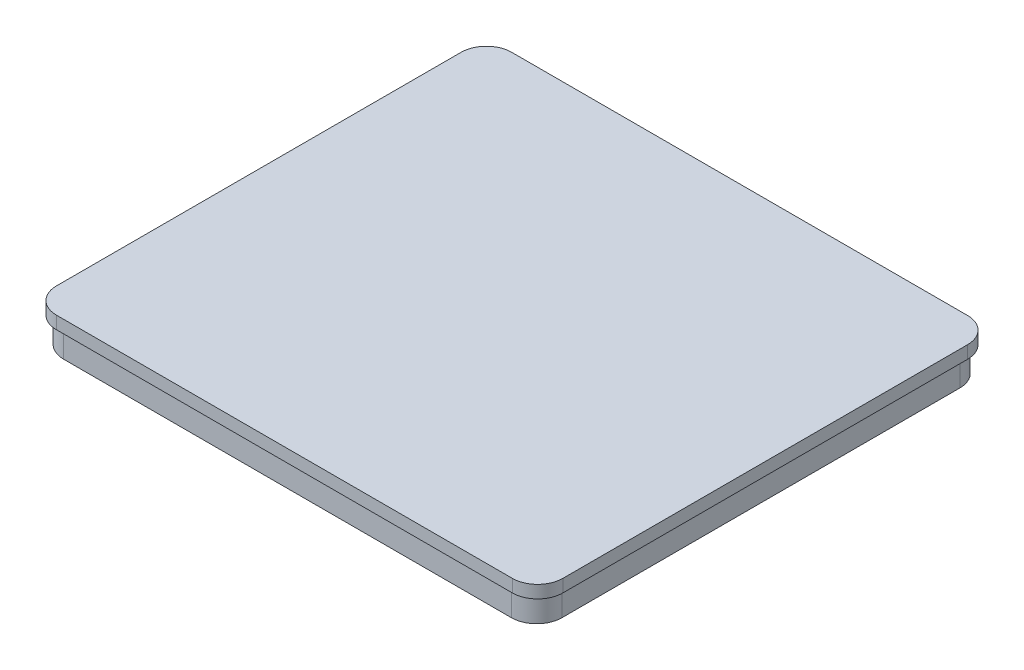
from build123d import *

# Parameters (mm, degrees)
BOSS_EXTRUDE1_DEPTH = 5
BOSS_EXTRUDE2_DEPTH = 15
SKETCH3_W           = 0.569871795
SKETCH3_H           = 2.320192307
SKETCH3_W_2         = 0.569871794
SKETCH3_H_2         = 3.256410256
CUT_EXTRUDE1_DEPTH  = 0.8


with BuildPart() as part:
    # Sketch1 → Boss-Extrude1 (new body)
    with BuildSketch(Plane(origin=(0, 0, 0), x_dir=(1, 0, 0), z_dir=(0, 1, 0))):
        with BuildLine():
            Line((-64.480238402, 42.53213614), (115.952940285, 42.53213614))
            ThreePointArc((115.952940285, 42.53213614), (123.024008096, 39.603203952), (125.952940285, 32.53213614))
            Line((125.952940285, 32.53213614), (125.952940285, -127.634130933))
            ThreePointArc((125.952940285, -127.634130933), (123.024008096, -134.705198745), (115.952940285, -137.634130933))
            Line((115.952940285, -137.634130933), (-64.480238402, -137.634130933))
            ThreePointArc((-64.480238402, -137.634130933), (-71.551306214, -134.705198745), (-74.480238402, -127.634130933))
            Line((-74.480238402, -127.634130933), (-74.480238402, 32.53213614))
            ThreePointArc((-74.480238402, 32.53213614), (-71.551306214, 39.603203952), (-64.480238402, 42.53213614))
        make_face()
    extrude(amount=BOSS_EXTRUDE1_DEPTH)

    # Sketch2 → Boss-Extrude2 (add)
    with BuildSketch(Plane(origin=(0, 5, 0), x_dir=(1, 0, 0), z_dir=(0, 1, 0))):
        with BuildLine():
            Line((-62.928230494, 41.12357609), (114.271952846, 41.12357609))
            ThreePointArc((114.271952846, 41.12357609), (121.343020657, 38.194643902), (124.271952846, 31.12357609))
            Line((124.271952846, 31.12357609), (124.271952846, -126.320002611))
            ThreePointArc((124.271952846, -126.320002611), (121.343020657, -133.391070423), (114.271952846, -136.320002611))
            Line((114.271952846, -136.320002611), (-62.928230494, -136.320002611))
            ThreePointArc((-62.928230494, -136.320002611), (-69.999298306, -133.391070423), (-72.928230494, -126.320002611))
            Line((-72.928230494, -126.320002611), (-72.928230494, 31.12357609))
            ThreePointArc((-72.928230494, 31.12357609), (-69.999298306, 38.194643902), (-62.928230494, 41.12357609))
        make_face()
        with BuildLine():
            Line((-59.269600006, 37.099082552), (109.881596259, 37.099082552))
            ThreePointArc((109.881596259, 37.099082552), (116.952664071, 34.170150364), (119.881596259, 27.099082552))
            Line((119.881596259, 27.099082552), (119.881596259, -121.929646025))
            ThreePointArc((119.881596259, -121.929646025), (116.952664071, -129.000713837), (109.881596259, -131.929646025))
            Line((109.881596259, -131.929646025), (-59.269600006, -131.929646025))
            ThreePointArc((-59.269600006, -131.929646025), (-66.340667818, -129.000713837), (-69.269600006, -121.929646025))
            Line((-69.269600006, -121.929646025), (-69.269600006, 27.099082552))
            ThreePointArc((-69.269600006, 27.099082552), (-66.340667818, 34.170150364), (-59.269600006, 37.099082552))
        make_face(mode=Mode.SUBTRACT)
    extrude(amount=-BOSS_EXTRUDE2_DEPTH)

    # Sketch3 → Cut-Extrude1 (cut)
    # profile 1 of 29: a face of its own
    with BuildSketch(Plane.ZY.offset(-119.881596259)):
        with BuildLine():
            Line((24.186281878, -2.455989963), (24.756153673, -2.455989963))
            Line((24.756153673, -2.455989963), (24.756153673, -5.712400219))
            Line((24.756153673, -5.712400219), (24.186281878, -5.712400219))
            Line((24.186281878, -5.712400219), (24.186281878, -5.459265203))
            add(Edge.make_bspline(
                [(24.186281878, -5.459265203), (24.15804494, -5.483905095), (24.103242621, -5.53172626), (24.016891898, -5.593775438), (23.930288849, -5.644957989), (23.843017343, -5.685722101), (23.753736054, -5.715822201), (23.661802192, -5.737615377), (23.565891812, -5.750467346), (23.500693257, -5.752216854), (23.467581958, -5.753105347)],
                knots=[0, 0, 0, 0, 1.129196829, 2.191548051, 3.199897424, 4.157751732, 5.089409408, 6.034969131, 7.002052659, 8, 8, 8, 8], degree=3))
            add(Edge.make_bspline(
                [(23.467581958, -5.753105347), (23.430413053, -5.752269163), (23.35696519, -5.750616816), (23.249188605, -5.733223196), (23.145119598, -5.706598383), (23.044842643, -5.668920946), (22.948540185, -5.620098373), (22.855475218, -5.561404515), (22.767243161, -5.490778865), (22.68310951, -5.411277215), (22.606077244, -5.323824835), (22.538734909, -5.229635552), (22.481970326, -5.130045231), (22.435466141, -5.025384062), (22.398884594, -4.91572886), (22.372807185, -4.800731832), (22.357421484, -4.680351905), (22.355517168, -4.598353814), (22.354551108, -4.556756189)],
                knots=[0, 0, 0, 0, 0.980476535, 1.937477201, 2.874147792, 3.812856188, 4.758993464, 5.720109578, 6.712210464, 7.737600662, 8.772720504, 9.783789959, 10.789002326, 11.793715968, 12.802552247, 13.835794126, 14.902098527, 16, 16, 16, 16], degree=3))
            add(Edge.make_bspline(
                [(22.354551108, -4.556756189), (22.355564992, -4.513681793), (22.357553836, -4.429186566), (22.372102115, -4.305193838), (22.397698298, -4.187345468), (22.432600532, -4.075478218), (22.477496196, -3.969572761), (22.532176115, -3.869455592), (22.597384158, -3.7753884), (22.672524868, -3.688972275), (22.75365838, -3.609767722), (22.840456894, -3.540813878), (22.931563071, -3.482234378), (23.027073729, -3.434410774), (23.126975227, -3.397455113), (23.230873157, -3.370437507), (23.339228751, -3.354225995), (23.413041459, -3.352418059), (23.450409482, -3.351502783)],
                knots=[0, 0, 0, 0, 1.136281865, 2.228943489, 3.287578264, 4.313574083, 5.316051562, 6.317280042, 7.318008486, 8.329309503, 9.333984563, 10.305318864, 11.248632312, 12.186624717, 13.117503092, 14.05354244, 15.014596925, 16, 16, 16, 16], degree=3))
            add(Edge.make_bspline(
                [(23.450409482, -3.351502783), (23.485002063, -3.352600296), (23.553408894, -3.354770628), (23.654457566, -3.368432326), (23.75168558, -3.394156112), (23.846273766, -3.427299318), (23.936993716, -3.47189877), (24.024332827, -3.525473388), (24.108521223, -3.588703556), (24.160033975, -3.63760041), (24.186281878, -3.662515404)],
                knots=[0, 0, 0, 0, 1.011899165, 2.001030639, 2.974036179, 3.948778736, 4.92769327, 5.924124564, 6.942254589, 8, 8, 8, 8], degree=3))
            Line((24.186281878, -3.662515404), (24.186281878, -2.455989963))
        make_face()
        with BuildLine():
            add(Edge.make_bspline(
                [(23.569980796, -3.88066945), (23.547273085, -3.881366201), (23.502767454, -3.882731787), (23.437315832, -3.890945885), (23.374763717, -3.90541949), (23.315557225, -3.926801135), (23.258813961, -3.952847093), (23.20539558, -3.985469226), (23.154861206, -4.024027895), (23.107508036, -4.067589594), (23.064338644, -4.115471866), (23.027124108, -4.167721799), (22.995497765, -4.222931555), (22.968750099, -4.281267129), (22.949604838, -4.343418813), (22.9344418, -4.408577501), (22.926573164, -4.477275507), (22.925146829, -4.524091073), (22.924422903, -4.547851942)],
                knots=[0, 0, 0, 0, 1.04836806, 2.054732945, 3.03993516, 4.00574415, 4.955904794, 5.917688631, 6.888591924, 7.88601754, 8.884115178, 9.859153345, 10.841239365, 11.818093293, 12.814750328, 13.83810466, 14.90274714, 16, 16, 16, 16], degree=3))
            add(Edge.make_bspline(
                [(22.924422903, -4.547851942), (22.92513577, -4.571828336), (22.926540467, -4.619073543), (22.934569028, -4.688351042), (22.949186438, -4.754461545), (22.970512687, -4.816870596), (22.996556985, -4.876420298), (23.028258752, -4.932835823), (23.067198821, -4.985119675), (23.110406056, -5.034509065), (23.158730669, -5.078611874), (23.209550987, -5.117771118), (23.263561176, -5.150535634), (23.320175262, -5.177016122), (23.379202681, -5.198595494), (23.441383456, -5.212887196), (23.50610845, -5.222023611), (23.550233187, -5.223295916), (23.572524866, -5.223938681)],
                knots=[0, 0, 0, 0, 1.099136573, 2.165835871, 3.191374663, 4.196217796, 5.183857741, 6.167377911, 7.154730987, 8.166690795, 9.170734848, 10.148332609, 11.103258353, 12.059567475, 13.009337315, 13.978056681, 14.978520572, 16, 16, 16, 16], degree=3))
            add(Edge.make_bspline(
                [(23.572524866, -5.223938681), (23.595655535, -5.223238024), (23.64100422, -5.221864355), (23.707523652, -5.21372522), (23.770916066, -5.199198546), (23.830917718, -5.177694487), (23.888445074, -5.151835487), (23.942979002, -5.119850815), (23.993927727, -5.081380627), (24.041549281, -5.037425129), (24.085185254, -4.98915187), (24.122914437, -4.936216762), (24.155777936, -4.880312816), (24.181623566, -4.820118258), (24.20214862, -4.756686212), (24.216874874, -4.689623006), (24.224885102, -4.618856337), (24.226277513, -4.570555328), (24.226987006, -4.545943889)],
                knots=[0, 0, 0, 0, 1.050008698, 2.058587853, 3.036635738, 3.995319155, 4.947022481, 5.895997462, 6.858296291, 7.838991643, 8.833936038, 9.806048392, 10.784806122, 11.771666913, 12.772873988, 13.80724452, 14.882696879, 16, 16, 16, 16], degree=3))
            add(Edge.make_bspline(
                [(24.226987006, -4.545943889), (24.226286329, -4.521755755), (24.224917703, -4.474509303), (24.216840328, -4.405220209), (24.202009526, -4.339473818), (24.181906911, -4.277149279), (24.15560148, -4.218389099), (24.122713116, -4.163844785), (24.0853978, -4.111626583), (24.041278713, -4.064657451), (23.993915136, -4.021020225), (23.942217128, -3.983713404), (23.887813455, -3.951561351), (23.830369862, -3.925163275), (23.769354446, -3.905812485), (23.705853698, -3.890829876), (23.638876875, -3.882736717), (23.593320924, -3.881369784), (23.569980796, -3.88066945)],
                knots=[0, 0, 0, 0, 1.106611376, 2.161533483, 3.185006901, 4.184773755, 5.152708835, 6.122342771, 7.094156588, 8.082475533, 9.064254463, 10.03606828, 10.992420271, 11.951521816, 12.920622147, 13.915721683, 14.932141191, 16, 16, 16, 16], degree=3))
        make_face(mode=Mode.SUBTRACT)
    # profile 2 of 29: a face of its own
    with BuildSketch(Plane.ZY.offset(-119.881596259)):
        with BuildLine():
            Line((27.644309722, -4.694772014), (25.814487006, -4.694772014))
            add(Edge.make_bspline(
                [(25.814487006, -4.694772014), (25.818217867, -4.716033516), (25.825549302, -4.757814045), (25.841469776, -4.818503888), (25.861786687, -4.875696972), (25.886135227, -4.929469749), (25.914104877, -4.980106496), (25.946729158, -5.027369707), (25.983594258, -5.071217634), (26.024487035, -5.111459711), (26.068725879, -5.147517484), (26.116096249, -5.179106373), (26.166647029, -5.205007329), (26.219798671, -5.226839148), (26.275948342, -5.24413216), (26.33517868, -5.256058821), (26.397332673, -5.263103944), (26.439673873, -5.26412294), (26.461316934, -5.264643809)],
                knots=[0, 0, 0, 0, 1.091296461, 2.144483647, 3.168565212, 4.157007626, 5.126487748, 6.090021542, 7.05641414, 8.019231907, 8.98705074, 9.938580405, 10.892824166, 11.854447369, 12.841318655, 13.858982407, 14.905600794, 16, 16, 16, 16], degree=3))
            add(Edge.make_bspline(
                [(26.461316934, -5.264643809), (26.487441578, -5.263954093), (26.538888696, -5.262595839), (26.614259106, -5.250550147), (26.687153272, -5.232355659), (26.756881358, -5.205298927), (26.824251054, -5.171618052), (26.888153249, -5.129655827), (26.949694038, -5.080638524), (26.987241172, -5.042856005), (27.006384041, -5.023593128)],
                knots=[0, 0, 0, 0, 1.021034703, 2.010718019, 2.977989445, 3.954245119, 4.929443971, 5.918328161, 6.938689359, 8, 8, 8, 8], degree=3))
            Line((27.006384041, -5.023593128), (27.483397262, -5.250651421))
            add(Edge.make_bspline(
                [(27.483397262, -5.250651421), (27.468378779, -5.271404659), (27.438620208, -5.312526438), (27.390040339, -5.370395401), (27.339344152, -5.424389491), (27.286493838, -5.474153581), (27.23142237, -5.519545862), (27.174282943, -5.561119296), (27.114240488, -5.597757651), (27.052495543, -5.631233469), (26.987771726, -5.659932133), (26.920248156, -5.684405341), (26.850210833, -5.706528912), (26.776775337, -5.723385861), (26.700553165, -5.736729685), (26.621361979, -5.746205568), (26.539212215, -5.752058366), (26.4833755, -5.752752208), (26.454956758, -5.753105347)],
                knots=[0, 0, 0, 0, 1.028154879, 2.037251081, 3.030720504, 4.000128189, 4.949298328, 5.894184978, 6.834267904, 7.770992897, 8.712077017, 9.673380525, 10.653304757, 11.658697181, 12.695551717, 13.758623199, 14.859225354, 16, 16, 16, 16], degree=3))
            add(Edge.make_bspline(
                [(26.454956758, -5.753105347), (26.411234989, -5.752213992), (26.325608426, -5.750468324), (26.200364098, -5.734266027), (26.081416725, -5.707400871), (25.968430439, -5.670881818), (25.861893644, -5.622665227), (25.761753614, -5.563692337), (25.667009807, -5.495093776), (25.580557175, -5.415429842), (25.501796276, -5.328720386), (25.4326176, -5.235600352), (25.374729869, -5.136720334), (25.3271913, -5.03273474), (25.290242673, -4.923377408), (25.263604856, -4.808600617), (25.247275555, -4.688459186), (25.245511909, -4.606629461), (25.244615211, -4.565024418)],
                knots=[0, 0, 0, 0, 1.103565453, 2.161269334, 3.182010356, 4.179077853, 5.15417608, 6.128274628, 7.109042802, 8.101804412, 9.090965879, 10.063106201, 11.02526161, 11.978650795, 12.945248442, 13.93468508, 14.949922959, 16, 16, 16, 16], degree=3))
            add(Edge.make_bspline(
                [(25.244615211, -4.565024418), (25.245520734, -4.522362137), (25.247302311, -4.438426017), (25.26346426, -4.315510465), (25.290316317, -4.198232404), (25.327373027, -4.08643033), (25.37419043, -3.979754572), (25.432814684, -3.879138416), (25.501761947, -3.784231572), (25.580239111, -3.695478023), (25.667057983, -3.615368249), (25.759311237, -3.54397443), (25.858035433, -3.484484362), (25.962113915, -3.436416424), (26.070880959, -3.397362437), (26.185593762, -3.371375271), (26.305379532, -3.353926444), (26.387262447, -3.352319516), (26.428880035, -3.351502783)],
                knots=[0, 0, 0, 0, 1.079208495, 2.12329425, 3.130605359, 4.119693003, 5.099659317, 6.073216462, 7.060498243, 8.06384408, 9.066070512, 10.045757761, 11.010926815, 11.975797609, 12.942977511, 13.929384301, 14.947594487, 16, 16, 16, 16], degree=3))
            add(Edge.make_bspline(
                [(26.428880035, -3.351502783), (26.47281126, -3.352407967), (26.559065693, -3.354185203), (26.685182309, -3.370255942), (26.804919479, -3.397284918), (26.91878735, -3.433488197), (27.025331783, -3.48292279), (27.126893882, -3.540444451), (27.221037612, -3.610525822), (27.308766445, -3.689799906), (27.387959647, -3.777751755), (27.457183279, -3.8732944), (27.516084071, -3.975495403), (27.563823747, -4.084769208), (27.600734434, -4.200787767), (27.62739691, -4.323400405), (27.643601657, -4.453073483), (27.645332485, -4.541868071), (27.646217775, -4.587285035)],
                knots=[0, 0, 0, 0, 1.080001299, 2.120471247, 3.119684163, 4.095710327, 5.052285597, 6.002875087, 6.961153713, 7.931888285, 8.906493152, 9.865905668, 10.82813294, 11.801621613, 12.7925306, 13.817193356, 14.883530496, 16, 16, 16, 16], degree=3))
            Line((27.646217775, -4.587285035), (27.644309722, -4.694772014))
        make_face()
        with BuildLine():
            add(Edge.make_bspline(
                [(27.07634598, -4.247015604), (27.065592151, -4.217995375), (27.044210737, -4.160295599), (26.995911012, -4.080683988), (26.931818823, -4.0117371), (26.85727501, -3.950697873), (26.772104035, -3.901154623), (26.678989785, -3.865283702), (26.579109208, -3.843775047), (26.510396752, -3.84125246), (26.475309322, -3.839964322)],
                knots=[0, 0, 0, 0, 0.954238005, 1.897273737, 2.851915805, 3.847685534, 4.862635127, 5.880135777, 6.917509367, 8, 8, 8, 8], degree=3))
            add(Edge.make_bspline(
                [(26.475309322, -3.839964322), (26.436988134, -3.841201735), (26.362078193, -3.84362062), (26.254025702, -3.869346351), (26.152102492, -3.907741235), (26.092014343, -3.947327176), (26.061897863, -3.967167847)],
                knots=[0, 0, 0, 0, 1.044195649, 2.041185066, 3.018232172, 4, 4, 4, 4], degree=3))
            add(Edge.make_bspline(
                [(26.061897863, -3.967167847), (26.043107429, -3.982278937), (26.003047184, -4.014495009), (25.951020828, -4.078763012), (25.899774434, -4.156577137), (25.870638034, -4.215682462), (25.855192134, -4.247015604)],
                knots=[0, 0, 0, 0, 0.82159062, 1.751589201, 2.808063854, 4, 4, 4, 4], degree=3))
            Line((25.855192134, -4.247015604), (27.07634598, -4.247015604))
        make_face(mode=Mode.SUBTRACT)
    # profile 3 of 29: a face of its own
    with BuildSketch(Plane.ZY.offset(-119.881596259)):
        with BuildLine():
            Line((29.559358801, -3.750285836), (29.210821141, -4.124900219))
            add(Edge.make_bspline(
                [(29.210821141, -4.124900219), (29.193416985, -4.105641578), (29.16012943, -4.068807093), (29.109169399, -4.018593457), (29.058968262, -3.976780331), (29.010461514, -3.941655563), (28.962658473, -3.914719065), (28.915956491, -3.895338857), (28.870333159, -3.883036014), (28.840092086, -3.881443457), (28.825394458, -3.88066945)],
                knots=[0, 0, 0, 0, 1.327646587, 2.539285, 3.655602211, 4.666613517, 5.598770349, 6.454635452, 7.248928967, 8, 8, 8, 8], degree=3))
            add(Edge.make_bspline(
                [(28.825394458, -3.88066945), (28.810521934, -3.881122714), (28.782045678, -3.881990572), (28.7418593, -3.889434624), (28.706552878, -3.902321648), (28.676677392, -3.919887864), (28.652674897, -3.941527638), (28.635869632, -3.966283028), (28.624584741, -3.993384085), (28.623630113, -4.012635012), (28.623140852, -4.022501381)],
                knots=[0, 0, 0, 0, 1.295068245, 2.479652818, 3.543291146, 4.55379989, 5.481948265, 6.332409746, 7.145336708, 8, 8, 8, 8], degree=3))
            add(Edge.make_bspline(
                [(28.623140852, -4.022501381), (28.624798512, -4.037453195), (28.628237962, -4.068476471), (28.65186222, -4.104458843), (28.683118819, -4.131002302), (28.71914864, -4.155702515), (28.767942345, -4.183319998), (28.804958488, -4.202230495), (28.825394458, -4.212670652)],
                knots=[0, 0, 0, 0, 0.916701701, 1.902049539, 2.5493345, 3.440293453, 4.586830489, 6, 6, 6, 6], degree=3))
            Line((28.825394458, -4.212670652), (29.031464169, -4.316977543))
            add(Edge.make_bspline(
                [(29.031464169, -4.316977543), (29.057680177, -4.33028918), (29.108544156, -4.356116256), (29.180054145, -4.397791712), (29.246101911, -4.438186556), (29.305362556, -4.479585816), (29.358198791, -4.521270247), (29.404235325, -4.563652053), (29.444588774, -4.605387651), (29.489588534, -4.661343678), (29.5346018, -4.735872553), (29.572128884, -4.832793882), (29.596059449, -4.936575315), (29.59870709, -5.008406403), (29.600063929, -5.045217727)],
                knots=[0, 0, 0, 0, 1.076693506, 2.088987655, 3.030641824, 3.911722491, 4.735175175, 5.493635918, 6.202154166, 6.859459289, 8.120623445, 9.372284821, 10.653373066, 12, 12, 12, 12], degree=3))
            add(Edge.make_bspline(
                [(29.600063929, -5.045217727), (29.599246425, -5.070052212), (29.597646353, -5.11865989), (29.587531035, -5.190205757), (29.569361304, -5.258235284), (29.545449965, -5.323808915), (29.513242109, -5.385740878), (29.474140193, -5.444331399), (29.428761652, -5.500349739), (29.375906838, -5.551879621), (29.318005273, -5.599904907), (29.253637912, -5.640297621), (29.1856508, -5.6758121), (29.112247826, -5.703545747), (29.034458924, -5.726030365), (28.951617282, -5.741611643), (28.864004, -5.75141734), (28.804009072, -5.752533124), (28.773241012, -5.753105347)],
                knots=[0, 0, 0, 0, 0.976600749, 1.911466839, 2.833459288, 3.740827163, 4.650527853, 5.570709661, 6.506801416, 7.479409329, 8.468875524, 9.458587492, 10.461481786, 11.480119772, 12.538142914, 13.641687514, 14.790552763, 16, 16, 16, 16], degree=3))
            add(Edge.make_bspline(
                [(28.773241012, -5.753105347), (28.732475975, -5.751807207), (28.652457797, -5.749259073), (28.535597041, -5.731509133), (28.425249462, -5.700783687), (28.321324276, -5.657741268), (28.223184956, -5.602893427), (28.13223304, -5.534839263), (28.046891795, -5.455351873), (27.997239372, -5.394388747), (27.971858801, -5.363226541)],
                knots=[0, 0, 0, 0, 1.056901255, 2.07460411, 3.05625841, 4.019970729, 4.984811261, 5.963335951, 6.958928997, 8, 8, 8, 8], degree=3))
            Line((27.971858801, -5.363226541), (28.317216373, -4.979707912))
            add(Edge.make_bspline(
                [(28.317216373, -4.979707912), (28.33404336, -4.997456056), (28.367450433, -5.032691927), (28.423761258, -5.079155187), (28.483342099, -5.12150303), (28.546856233, -5.157061401), (28.610383201, -5.185773185), (28.671332086, -5.20731104), (28.728554238, -5.220846128), (28.765758606, -5.222943285), (28.783417294, -5.223938681)],
                knots=[0, 0, 0, 0, 1.087861918, 2.159761696, 3.243809206, 4.338405912, 5.394481878, 6.343674753, 7.213841449, 8, 8, 8, 8], degree=3))
            add(Edge.make_bspline(
                [(28.783417294, -5.223938681), (28.801066425, -5.22342755), (28.834992924, -5.222445016), (28.883211264, -5.212224733), (28.925949402, -5.195042926), (28.962192933, -5.171219916), (28.992339333, -5.143874739), (29.013580763, -5.112796784), (29.027626721, -5.079842324), (29.029333843, -5.056801819), (29.030192134, -5.045217727)],
                knots=[0, 0, 0, 0, 1.255011871, 2.412479185, 3.488767498, 4.514443302, 5.48617286, 6.365347346, 7.178144445, 8, 8, 8, 8], degree=3))
            add(Edge.make_bspline(
                [(29.030192134, -5.045217727), (29.029426284, -5.034308866), (29.027853846, -5.011910871), (29.015404807, -4.978849827), (28.995859569, -4.946114089), (28.968751391, -4.91361136), (28.933719564, -4.881605361), (28.890889457, -4.850352449), (28.841249163, -4.818185243), (28.804582016, -4.798985728), (28.785325347, -4.788902623)],
                knots=[0, 0, 0, 0, 0.704666567, 1.446816302, 2.258757648, 3.165368109, 4.175243826, 5.322435858, 6.59381024, 8, 8, 8, 8], degree=3))
            Line((28.785325347, -4.788902623), (28.596428112, -4.693499979))
            add(Edge.make_bspline(
                [(28.596428112, -4.693499979), (28.553578678, -4.670522398), (28.471323831, -4.626414059), (28.360146026, -4.55077763), (28.266050065, -4.470261146), (28.188959266, -4.38529717), (28.127533165, -4.296124129), (28.084684338, -4.201606679), (28.057728513, -4.102640864), (28.05476294, -4.034966966), (28.053269057, -4.000876782)],
                knots=[0, 0, 0, 0, 1.255999728, 2.41104856, 3.467751088, 4.449286722, 5.368722015, 6.253902015, 7.120417131, 8, 8, 8, 8], degree=3))
            add(Edge.make_bspline(
                [(28.053269057, -4.000876782), (28.053787123, -3.978782729), (28.054804172, -3.935408513), (28.065631261, -3.871710471), (28.08198867, -3.81048046), (28.105070735, -3.75162124), (28.134638458, -3.695074408), (28.170864048, -3.641090914), (28.214189455, -3.5897689), (28.263227649, -3.541273687), (28.317637064, -3.497107007), (28.375863141, -3.457965002), (28.437733657, -3.424623291), (28.503756376, -3.398040908), (28.573092113, -3.376882985), (28.646198557, -3.362501339), (28.722763804, -3.353354561), (28.775122222, -3.352128789), (28.801861806, -3.351502783)],
                knots=[0, 0, 0, 0, 0.959035663, 1.882742823, 2.798841253, 3.708806893, 4.623422363, 5.566085165, 6.527241613, 7.536786942, 8.55815439, 9.567237405, 10.580975912, 11.605536372, 12.654523293, 13.725718749, 14.838518481, 16, 16, 16, 16], degree=3))
            add(Edge.make_bspline(
                [(28.801861806, -3.351502783), (28.838829453, -3.352719911), (28.912203713, -3.355135694), (29.020416315, -3.374684227), (29.124938464, -3.407540799), (29.225477135, -3.452811661), (29.320739088, -3.509704268), (29.408629466, -3.578791107), (29.48974308, -3.658370949), (29.535923128, -3.719343296), (29.559358801, -3.750285836)],
                knots=[0, 0, 0, 0, 0.996590028, 1.978055413, 2.954661574, 3.945146934, 4.945404762, 5.939399542, 6.954276554, 8, 8, 8, 8], degree=3))
        make_face()
    # profile 4 of 29: a face of its own
    with BuildSketch(Plane.ZY.offset(-119.881596259)):
        with BuildLine():
            add(Edge.make_bspline(
                [(30.331484201, -2.415284835), (30.356045672, -2.416489913), (30.404274485, -2.418856201), (30.473368823, -2.441922247), (30.536783423, -2.478123716), (30.592843687, -2.527792994), (30.639469373, -2.587107197), (30.675093129, -2.653513391), (30.694937639, -2.727089315), (30.697693748, -2.777914794), (30.699102391, -2.803891605)],
                knots=[0, 0, 0, 0, 0.989868614, 1.943702388, 2.910836514, 3.924849579, 4.949916355, 5.946401046, 6.950409252, 8, 8, 8, 8], degree=3))
            add(Edge.make_bspline(
                [(30.699102391, -2.803891605), (30.697744147, -2.829676982), (30.695097545, -2.879921016), (30.674636395, -2.952498112), (30.640442453, -3.018872053), (30.593439129, -3.07730533), (30.537986631, -3.126174655), (30.475957689, -3.16303334), (30.407525475, -3.184816227), (30.360045027, -3.187380323), (30.335936325, -3.18868227)],
                knots=[0, 0, 0, 0, 1.05296456, 2.051751585, 3.055639087, 4.085634717, 5.099016424, 6.062201612, 7.016062274, 8, 8, 8, 8], degree=3))
            add(Edge.make_bspline(
                [(30.335936325, -3.18868227), (30.311160453, -3.1874815), (30.262512051, -3.185123739), (30.192850997, -3.162003724), (30.128590609, -3.126087365), (30.072773533, -3.075403267), (30.025613879, -3.015667591), (29.991546183, -2.947715404), (29.970235997, -2.873636369), (29.967706496, -2.82205813), (29.966410083, -2.795623376)],
                knots=[0, 0, 0, 0, 0.989065327, 1.942068821, 2.907541208, 3.917690034, 4.939857478, 5.938239964, 6.943311734, 8, 8, 8, 8], degree=3))
            add(Edge.make_bspline(
                [(29.966410083, -2.795623376), (29.967820935, -2.770275851), (29.970592351, -2.720484297), (29.990555732, -2.648544181), (30.025362636, -2.583254379), (30.071652472, -2.525025978), (30.127220339, -2.476283218), (30.19059687, -2.441181212), (30.259226201, -2.41906786), (30.307149502, -2.416558863), (30.331484201, -2.415284835)],
                knots=[0, 0, 0, 0, 1.038616768, 2.040212704, 3.031499824, 4.052181184, 5.074969369, 6.039807101, 7.004644834, 8, 8, 8, 8], degree=3))
        make_face()
    # profile 5 of 29: a face of its own
    with BuildSketch(Plane.ZY.offset(-119.881596259)):
        with Locations((30.332756237, -4.552304066)):
            Rectangle(SKETCH3_W, SKETCH3_H)
    # profile 6 of 29: a face of its own
    with BuildSketch(Plane.ZY.offset(-119.881596259)):
        with BuildLine():
            Line((32.856474185, -3.392207912), (33.467051108, -3.392207912))
            Line((33.467051108, -3.392207912), (33.467051108, -5.37149477))
            add(Edge.make_bspline(
                [(33.467051108, -5.37149477), (33.466317354, -5.418793423), (33.464900445, -5.510128978), (33.454091862, -5.642497788), (33.436067157, -5.765210957), (33.410130242, -5.878442273), (33.376631469, -5.981775559), (33.335661199, -6.075554347), (33.288052443, -6.160281546), (33.248907448, -6.209789681), (33.229816533, -6.233934674)],
                knots=[0, 0, 0, 0, 1.243822755, 2.401870584, 3.490053692, 4.503076575, 5.453444971, 6.342269266, 7.191528908, 8, 8, 8, 8], degree=3))
            add(Edge.make_bspline(
                [(33.229816533, -6.233934674), (33.202401716, -6.264005603), (33.147710875, -6.323995218), (33.051287858, -6.39969999), (32.945652891, -6.464403498), (32.829727951, -6.517431125), (32.703651117, -6.557821259), (32.567746269, -6.586909354), (32.421927247, -6.60502679), (32.32121395, -6.606932946), (32.269429915, -6.60791304)],
                knots=[0, 0, 0, 0, 0.916003385, 1.827369254, 2.751972866, 3.703651841, 4.69362366, 5.730423306, 6.83304546, 8, 8, 8, 8], degree=3))
            add(Edge.make_bspline(
                [(32.269429915, -6.60791304), (32.214691193, -6.607065618), (32.109414538, -6.605435809), (31.958134154, -6.589492535), (31.820332302, -6.563258979), (31.695361866, -6.526325849), (31.582058562, -6.478671431), (31.478285776, -6.421531034), (31.384242801, -6.353214986), (31.298508133, -6.276416549), (31.223070121, -6.189449192), (31.15865346, -6.093109159), (31.103773814, -5.988282587), (31.076676364, -5.913319597), (31.062904474, -5.875220732)],
                knots=[0, 0, 0, 0, 1.29412125, 2.488928388, 3.592140377, 4.607309753, 5.564519828, 6.493640275, 7.402258018, 8.307438948, 9.210158992, 10.116782752, 11.042881838, 12, 12, 12, 12], degree=3))
            Line((31.062904474, -5.875220732), (31.696378032, -5.875220732))
            add(Edge.make_bspline(
                [(31.696378032, -5.875220732), (31.711016928, -5.891336762), (31.740480754, -5.923773625), (31.792594232, -5.964933808), (31.85024355, -6.000164917), (31.913893822, -6.029013518), (31.98381044, -6.050950292), (32.059517471, -6.067616349), (32.141354023, -6.077008545), (32.197748518, -6.07815529), (32.226816733, -6.078746373)],
                knots=[0, 0, 0, 0, 0.888971165, 1.789239437, 2.70354581, 3.646217955, 4.638595249, 5.694475788, 6.811630907, 8, 8, 8, 8], degree=3))
            add(Edge.make_bspline(
                [(32.226816733, -6.078746373), (32.263551315, -6.078060008), (32.333711145, -6.076749112), (32.432971828, -6.062415884), (32.521613564, -6.041002879), (32.598356767, -6.00877683), (32.664566866, -5.970068911), (32.719802211, -5.925104631), (32.765410541, -5.875578027), (32.795243162, -5.828985593), (32.812970815, -5.786718702), (32.82504229, -5.750221849), (32.834209497, -5.708152603), (32.842554074, -5.661298346), (32.848791782, -5.60905544), (32.852924343, -5.551534561), (32.856507893, -5.488989135), (32.85648567, -5.445490713), (32.856474185, -5.423012198)],
                knots=[0, 0, 0, 0, 1.656375485, 3.163532, 4.516250129, 5.759907703, 6.905105653, 7.965920022, 8.961443813, 9.932912751, 10.442911961, 11.026787936, 11.664959534, 12.383728702, 13.174001396, 14.037595414, 14.985895623, 16, 16, 16, 16], degree=3))
            add(Edge.make_bspline(
                [(32.856474185, -5.423012198), (32.831508276, -5.447498407), (32.782789966, -5.495280632), (32.703703401, -5.556240463), (32.622744298, -5.606591783), (32.539447396, -5.646618877), (32.452156111, -5.675938018), (32.360357747, -5.696995188), (32.263006838, -5.709825658), (32.196115114, -5.711529697), (32.161942935, -5.712400219)],
                knots=[0, 0, 0, 0, 1.082007397, 2.111422008, 3.08419067, 4.02964304, 4.965866572, 5.929243163, 6.942137121, 8, 8, 8, 8], degree=3))
            add(Edge.make_bspline(
                [(32.161942935, -5.712400219), (32.124144529, -5.711527004), (32.049895055, -5.709811701), (31.940837858, -5.693142303), (31.836207175, -5.667206347), (31.735721267, -5.631101071), (31.640405482, -5.583166034), (31.548903442, -5.526136712), (31.462910947, -5.457018539), (31.381241627, -5.379669918), (31.307427017, -5.293693541), (31.242474725, -5.201355028), (31.187718314, -5.103291329), (31.14318878, -4.999593604), (31.107710125, -4.890697171), (31.083293257, -4.776012493), (31.068372653, -4.655733207), (31.066436206, -4.573760632), (31.065448544, -4.531951501)],
                knots=[0, 0, 0, 0, 1.007560175, 1.979205489, 2.935124557, 3.879618859, 4.820364716, 5.775815361, 6.749909327, 7.75781854, 8.772289371, 9.766897274, 10.764314289, 11.762244114, 12.772609037, 13.814079916, 14.885097635, 16, 16, 16, 16], degree=3))
            add(Edge.make_bspline(
                [(31.065448544, -4.531951501), (31.066311169, -4.487377305), (31.067997061, -4.400262593), (31.084523617, -4.273020431), (31.110239738, -4.152175514), (31.146950176, -4.037980623), (31.195179454, -3.930923934), (31.253462607, -3.830665749), (31.321249834, -3.736059575), (31.374909087, -3.679935694), (31.40190187, -3.651703104)],
                knots=[0, 0, 0, 0, 1.104124469, 2.157873671, 3.173961494, 4.162551312, 5.124378318, 6.07778831, 7.033049473, 8, 8, 8, 8], degree=3))
            add(Edge.make_bspline(
                [(31.40190187, -3.651703104), (31.427517631, -3.627629834), (31.477994769, -3.580192254), (31.560625687, -3.519321965), (31.646204164, -3.467113442), (31.735904005, -3.425117572), (31.829090492, -3.39167436), (31.926315299, -3.368278179), (32.027094998, -3.353852634), (32.095536672, -3.352291913), (32.130142054, -3.351502783)],
                knots=[0, 0, 0, 0, 1.042068658, 2.053448347, 3.038272799, 4.011764631, 4.986555969, 5.970496305, 6.973845226, 8, 8, 8, 8], degree=3))
            add(Edge.make_bspline(
                [(32.130142054, -3.351502783), (32.162615288, -3.35241462), (32.22696306, -3.354221484), (32.3222985, -3.366969666), (32.414614264, -3.38949118), (32.504921147, -3.420453528), (32.594176326, -3.460561723), (32.682302674, -3.51313124), (32.771086922, -3.575989524), (32.827423629, -3.625104478), (32.856474185, -3.650431069)],
                knots=[0, 0, 0, 0, 0.968122651, 1.918396369, 2.861262201, 3.796768263, 4.761417965, 5.77287463, 6.85156174, 8, 8, 8, 8], degree=3))
            Line((32.856474185, -3.650431069), (32.856474185, -3.392207912))
        make_face()
        with BuildLine():
            add(Edge.make_bspline(
                [(32.266249826, -3.88066945), (32.243970519, -3.881387365), (32.200108304, -3.882800754), (32.135644694, -3.890763929), (32.074468432, -3.905795185), (32.01583392, -3.925312746), (31.960454054, -3.95156773), (31.908221775, -3.983600915), (31.858517965, -4.020782602), (31.812924226, -4.063814423), (31.770661958, -4.11031129), (31.735177082, -4.161483743), (31.703553732, -4.214417939), (31.678961886, -4.271243924), (31.658626586, -4.330419562), (31.646198491, -4.393149045), (31.636268059, -4.458285801), (31.635640349, -4.502864771), (31.635320339, -4.525591325)],
                knots=[0, 0, 0, 0, 1.059154978, 2.085203149, 3.079850876, 4.048488546, 5.017545358, 5.985239295, 6.956545898, 7.961752598, 8.960830395, 9.936516972, 10.916356752, 11.886198968, 12.873933111, 13.883774911, 14.921139228, 16, 16, 16, 16], degree=3))
            add(Edge.make_bspline(
                [(31.635320339, -4.525591325), (31.635666736, -4.549159078), (31.636346584, -4.595413698), (31.645865067, -4.662798039), (31.659462081, -4.727288908), (31.68000149, -4.788099078), (31.705714934, -4.84602756), (31.736602749, -4.901045888), (31.77473203, -4.951838601), (31.817073295, -4.999523495), (31.863914175, -5.042636096), (31.914334239, -5.080134794), (31.967295429, -5.11251878), (32.023942594, -5.137768005), (32.083050066, -5.158228633), (32.145210678, -5.173087139), (32.210281586, -5.181115105), (32.2545693, -5.182520023), (32.277062126, -5.183233553)],
                knots=[0, 0, 0, 0, 1.097915424, 2.154794285, 3.166904039, 4.167166757, 5.140698173, 6.119085138, 7.101657521, 8.095747232, 9.089148684, 10.06378348, 11.021581144, 11.977080764, 12.949256321, 13.934658686, 14.951055324, 16, 16, 16, 16], degree=3))
            add(Edge.make_bspline(
                [(32.277062126, -5.183233553), (32.299147377, -5.182887273), (32.342449575, -5.182208329), (32.405615237, -5.172684075), (32.465964828, -5.158912808), (32.523389662, -5.139219863), (32.577571044, -5.113516295), (32.629236024, -5.082842985), (32.677288687, -5.04572479), (32.72264036, -5.003760116), (32.76356735, -4.95709651), (32.799692182, -4.906537105), (32.829367423, -4.852072771), (32.854644658, -4.794565796), (32.873359975, -4.733204974), (32.887570141, -4.668599631), (32.895905742, -4.600436789), (32.89674931, -4.553810777), (32.897179314, -4.530043448)],
                knots=[0, 0, 0, 0, 1.047368431, 2.053558439, 3.025081491, 3.983010266, 4.928381778, 5.867249904, 6.829345556, 7.804873619, 8.796055618, 9.770545002, 10.747991713, 11.735078325, 12.747239243, 13.787476531, 14.872179528, 16, 16, 16, 16], degree=3))
            add(Edge.make_bspline(
                [(32.897179314, -4.530043448), (32.896762131, -4.506486058), (32.895947562, -4.46048907), (32.88749425, -4.393192306), (32.873407579, -4.329397344), (32.854433024, -4.268577679), (32.829704933, -4.211096513), (32.798696015, -4.157488839), (32.763236, -4.106764768), (32.721483062, -4.060652095), (32.676479584, -4.018002193), (32.626864371, -3.981921286), (32.575118702, -3.950041499), (32.519495448, -3.924768332), (32.460685507, -3.904862535), (32.398594423, -3.891245837), (32.333538861, -3.881690802), (32.288970812, -3.881014322), (32.266249826, -3.88066945)],
                knots=[0, 0, 0, 0, 1.111098411, 2.169475416, 3.193737863, 4.190319778, 5.171520483, 6.139320596, 7.107999188, 8.085777416, 9.069626166, 10.027970922, 10.974971434, 11.932846196, 12.904000912, 13.89897495, 14.928888274, 16, 16, 16, 16], degree=3))
        make_face(mode=Mode.SUBTRACT)
    # profile 7 of 29: a face of its own
    with BuildSketch(Plane.ZY.offset(-119.881596259)):
        with BuildLine():
            Line((34.036922903, -3.392207912), (34.606794698, -3.392207912))
            Line((34.606794698, -3.392207912), (34.606794698, -3.637710716))
            add(Edge.make_bspline(
                [(34.606794698, -3.637710716), (34.639305602, -3.612423066), (34.701440258, -3.56409345), (34.795895664, -3.502472944), (34.885049872, -3.452039035), (34.970890226, -3.413676422), (35.055031814, -3.386076172), (35.13883737, -3.366247039), (35.223554928, -3.353549899), (35.28050569, -3.352184789), (35.30895816, -3.351502783)],
                knots=[0, 0, 0, 0, 1.276643801, 2.439914479, 3.493451431, 4.44993799, 5.350072675, 6.235028322, 7.118224225, 8, 8, 8, 8], degree=3))
            add(Edge.make_bspline(
                [(35.30895816, -3.351502783), (35.337819361, -3.352282175), (35.394476324, -3.353812186), (35.477900579, -3.364513374), (35.557604353, -3.384003628), (35.634483849, -3.409881413), (35.707756566, -3.444038606), (35.778320139, -3.484594731), (35.844658886, -3.533994834), (35.885513224, -3.571615581), (35.906178713, -3.590645412)],
                knots=[0, 0, 0, 0, 1.048836932, 2.058954983, 3.049370783, 4.026390553, 5.001981509, 5.982488534, 6.97947532, 8, 8, 8, 8], degree=3))
            add(Edge.make_bspline(
                [(35.906178713, -3.590645412), (35.922753195, -3.6082805), (35.956023466, -3.643679743), (35.997889921, -3.704256916), (36.033816049, -3.770297122), (36.063252518, -3.842562157), (36.085004884, -3.92144907), (36.101739275, -4.00600502), (36.111129234, -4.096703458), (36.112288468, -4.159012429), (36.112884442, -4.191046053)],
                knots=[0, 0, 0, 0, 0.889584746, 1.785680191, 2.700364693, 3.65222533, 4.649950538, 5.707241244, 6.821271309, 8, 8, 8, 8], degree=3))
            Line((36.112884442, -4.191046053), (36.112884442, -5.712400219))
            Line((36.112884442, -5.712400219), (35.543012647, -5.712400219))
            Line((35.543012647, -5.712400219), (35.543012647, -4.704948296))
            add(Edge.make_bspline(
                [(35.543012647, -4.704948296), (35.542892132, -4.672086969), (35.542661186, -4.609114336), (35.540888038, -4.518991034), (35.53742582, -4.437597989), (35.534270098, -4.364787007), (35.528074162, -4.300816616), (35.522486567, -4.245281835), (35.513912944, -4.19868648), (35.502757269, -4.148566184), (35.483276713, -4.094903242), (35.453034099, -4.038360466), (35.414667103, -3.990326118), (35.369742786, -3.950463453), (35.318310763, -3.918928428), (35.260992515, -3.896741574), (35.198095336, -3.882914182), (35.154269321, -3.881436731), (35.131509241, -3.88066945)],
                knots=[0, 0, 0, 0, 1.49886392, 2.872294502, 4.110984203, 5.214877267, 6.195405875, 7.042225351, 7.75923308, 8.355011229, 9.382752534, 10.352059385, 11.267231453, 12.171456522, 13.078624015, 14.003401117, 14.963110155, 16, 16, 16, 16], degree=3))
            add(Edge.make_bspline(
                [(35.131509241, -3.88066945), (35.1019088, -3.882170496), (35.044004583, -3.885106835), (34.960257717, -3.907249505), (34.883337616, -3.944907668), (34.81387278, -3.997018995), (34.752524804, -4.061356884), (34.701996983, -4.138087198), (34.66055379, -4.225358055), (34.642732601, -4.289079955), (34.633507439, -4.322065684)],
                knots=[0, 0, 0, 0, 0.984188326, 1.925263693, 2.85911992, 3.81709677, 4.80007086, 5.801799564, 6.862098548, 8, 8, 8, 8], degree=3))
            add(Edge.make_bspline(
                [(34.633507439, -4.322065684), (34.631214619, -4.332425073), (34.626101171, -4.355528594), (34.621896006, -4.394559466), (34.616046318, -4.440865818), (34.613854583, -4.495285663), (34.610043397, -4.557561454), (34.608633839, -4.627775582), (34.607221758, -4.705790369), (34.606941768, -4.760280733), (34.606794698, -4.788902623)],
                knots=[0, 0, 0, 0, 0.543362196, 1.211806945, 2.009705693, 2.934833164, 4.000995085, 5.207458376, 6.533175157, 8, 8, 8, 8], degree=3))
            Line((34.606794698, -4.788902623), (34.606794698, -5.712400219))
            Line((34.606794698, -5.712400219), (34.036922903, -5.712400219))
            Line((34.036922903, -5.712400219), (34.036922903, -3.392207912))
        make_face()
    # profile 8 of 29: a face of its own
    with BuildSketch(Plane.ZY.offset(-119.881596259)):
        with BuildLine():
            Line((39.001040491, -4.694772014), (37.171217775, -4.694772014))
            add(Edge.make_bspline(
                [(37.171217775, -4.694772014), (37.174948636, -4.716033516), (37.182280072, -4.757814045), (37.198200545, -4.818503888), (37.218517457, -4.875696972), (37.242865996, -4.929469749), (37.270835647, -4.980106496), (37.303459927, -5.027369707), (37.340325027, -5.071217634), (37.381217804, -5.111459711), (37.425456648, -5.147517484), (37.472827019, -5.179106373), (37.523377798, -5.205007329), (37.57652944, -5.226839148), (37.632679111, -5.24413216), (37.691909449, -5.256058821), (37.754063443, -5.263103944), (37.796404642, -5.26412294), (37.818047703, -5.264643809)],
                knots=[0, 0, 0, 0, 1.091296461, 2.144483647, 3.168565212, 4.157007626, 5.126487748, 6.090021542, 7.05641414, 8.019231907, 8.98705074, 9.938580405, 10.892824166, 11.854447369, 12.841318655, 13.858982407, 14.905600794, 16, 16, 16, 16], degree=3))
            add(Edge.make_bspline(
                [(37.818047703, -5.264643809), (37.844172347, -5.263954093), (37.895619465, -5.262595839), (37.970989876, -5.250550147), (38.043884042, -5.232355659), (38.113612127, -5.205298927), (38.180981824, -5.171618052), (38.244884018, -5.129655827), (38.306424807, -5.080638524), (38.343971941, -5.042856005), (38.36311481, -5.023593128)],
                knots=[0, 0, 0, 0, 1.021034703, 2.010718019, 2.977989445, 3.954245119, 4.929443971, 5.918328161, 6.938689359, 8, 8, 8, 8], degree=3))
            Line((38.36311481, -5.023593128), (38.840128032, -5.250651421))
            add(Edge.make_bspline(
                [(38.840128032, -5.250651421), (38.825109549, -5.271404659), (38.795350977, -5.312526438), (38.746771108, -5.370395401), (38.696074921, -5.424389491), (38.643224607, -5.474153581), (38.588153139, -5.519545862), (38.531013712, -5.561119296), (38.470971257, -5.597757651), (38.409226312, -5.631233469), (38.344502495, -5.659932133), (38.276978925, -5.684405341), (38.206941602, -5.706528912), (38.133506106, -5.723385861), (38.057283935, -5.736729685), (37.978092748, -5.746205568), (37.895942985, -5.752058366), (37.840106269, -5.752752208), (37.811687527, -5.753105347)],
                knots=[0, 0, 0, 0, 1.028154879, 2.037251081, 3.030720504, 4.000128189, 4.949298328, 5.894184978, 6.834267904, 7.770992897, 8.712077017, 9.673380525, 10.653304757, 11.658697181, 12.695551717, 13.758623199, 14.859225354, 16, 16, 16, 16], degree=3))
            add(Edge.make_bspline(
                [(37.811687527, -5.753105347), (37.767965758, -5.752213992), (37.682339195, -5.750468324), (37.557094867, -5.734266027), (37.438147494, -5.707400871), (37.325161208, -5.670881818), (37.218624413, -5.622665227), (37.118484383, -5.563692337), (37.023740576, -5.495093776), (36.937287944, -5.415429842), (36.858527046, -5.328720386), (36.789348369, -5.235600352), (36.731460638, -5.136720334), (36.683922069, -5.03273474), (36.646973442, -4.923377408), (36.620335625, -4.808600617), (36.604006324, -4.688459186), (36.602242678, -4.606629461), (36.60134598, -4.565024418)],
                knots=[0, 0, 0, 0, 1.103565453, 2.161269334, 3.182010356, 4.179077853, 5.15417608, 6.128274628, 7.109042802, 8.101804412, 9.090965879, 10.063106201, 11.02526161, 11.978650795, 12.945248442, 13.93468508, 14.949922959, 16, 16, 16, 16], degree=3))
            add(Edge.make_bspline(
                [(36.60134598, -4.565024418), (36.602251504, -4.522362137), (36.60403308, -4.438426017), (36.62019503, -4.315510465), (36.647047086, -4.198232404), (36.684103797, -4.08643033), (36.7309212, -3.979754572), (36.789545453, -3.879138416), (36.858492716, -3.784231572), (36.93696988, -3.695478023), (37.023788752, -3.615368249), (37.116042006, -3.54397443), (37.214766202, -3.484484362), (37.318844684, -3.436416424), (37.427611729, -3.397362437), (37.542324531, -3.371375271), (37.662110301, -3.353926444), (37.743993216, -3.352319516), (37.785610804, -3.351502783)],
                knots=[0, 0, 0, 0, 1.079208495, 2.12329425, 3.130605359, 4.119693003, 5.099659317, 6.073216462, 7.060498243, 8.06384408, 9.066070512, 10.045757761, 11.010926815, 11.975797609, 12.942977511, 13.929384301, 14.947594487, 16, 16, 16, 16], degree=3))
            add(Edge.make_bspline(
                [(37.785610804, -3.351502783), (37.829542029, -3.352407967), (37.915796463, -3.354185203), (38.041913079, -3.370255942), (38.161650248, -3.397284918), (38.275518119, -3.433488197), (38.382062552, -3.48292279), (38.483624651, -3.540444451), (38.577768382, -3.610525822), (38.665497214, -3.689799906), (38.744690416, -3.777751755), (38.813914048, -3.8732944), (38.87281484, -3.975495403), (38.920554516, -4.084769208), (38.957465204, -4.200787767), (38.984127679, -4.323400405), (39.000332426, -4.453073483), (39.002063254, -4.541868071), (39.002948544, -4.587285035)],
                knots=[0, 0, 0, 0, 1.080001299, 2.120471247, 3.119684163, 4.095710327, 5.052285597, 6.002875087, 6.961153713, 7.931888285, 8.906493152, 9.865905668, 10.82813294, 11.801621613, 12.7925306, 13.817193356, 14.883530496, 16, 16, 16, 16], degree=3))
            Line((39.002948544, -4.587285035), (39.001040491, -4.694772014))
        make_face()
        with BuildLine():
            add(Edge.make_bspline(
                [(38.43307675, -4.247015604), (38.42232292, -4.217995375), (38.400941506, -4.160295599), (38.352641782, -4.080683988), (38.288549593, -4.0117371), (38.214005779, -3.950697873), (38.128834804, -3.901154623), (38.035720555, -3.865283702), (37.935839977, -3.843775047), (37.867127522, -3.84125246), (37.832040091, -3.839964322)],
                knots=[0, 0, 0, 0, 0.954238005, 1.897273737, 2.851915805, 3.847685534, 4.862635127, 5.880135777, 6.917509367, 8, 8, 8, 8], degree=3))
            add(Edge.make_bspline(
                [(37.832040091, -3.839964322), (37.793718904, -3.841201735), (37.718808962, -3.84362062), (37.610756471, -3.869346351), (37.508833261, -3.907741235), (37.448745113, -3.947327176), (37.418628633, -3.967167847)],
                knots=[0, 0, 0, 0, 1.044195649, 2.041185066, 3.018232172, 4, 4, 4, 4], degree=3))
            add(Edge.make_bspline(
                [(37.418628633, -3.967167847), (37.399838198, -3.982278937), (37.359777953, -4.014495009), (37.307751597, -4.078763012), (37.256505203, -4.156577137), (37.227368803, -4.215682462), (37.211922903, -4.247015604)],
                knots=[0, 0, 0, 0, 0.82159062, 1.751589201, 2.808063854, 4, 4, 4, 4], degree=3))
            Line((37.211922903, -4.247015604), (38.43307675, -4.247015604))
        make_face(mode=Mode.SUBTRACT)
    # profile 9 of 29: a face of its own
    with BuildSketch(Plane.ZY.offset(-119.881596259)):
        with BuildLine():
            Line((41.241730596, -2.455989963), (41.811602391, -2.455989963))
            Line((41.811602391, -2.455989963), (41.811602391, -5.712400219))
            Line((41.811602391, -5.712400219), (41.241730596, -5.712400219))
            Line((41.241730596, -5.712400219), (41.241730596, -5.459265203))
            add(Edge.make_bspline(
                [(41.241730596, -5.459265203), (41.213493658, -5.483905095), (41.158691339, -5.53172626), (41.072340616, -5.593775438), (40.985737567, -5.644957989), (40.898466061, -5.685722101), (40.809184772, -5.715822201), (40.71725091, -5.737615377), (40.62134053, -5.750467346), (40.556141975, -5.752216854), (40.523030676, -5.753105347)],
                knots=[0, 0, 0, 0, 1.129196829, 2.191548051, 3.199897424, 4.157751732, 5.089409408, 6.034969131, 7.002052659, 8, 8, 8, 8], degree=3))
            add(Edge.make_bspline(
                [(40.523030676, -5.753105347), (40.485861771, -5.752269163), (40.412413908, -5.750616816), (40.304637323, -5.733223196), (40.200568315, -5.706598383), (40.10029136, -5.668920946), (40.003988903, -5.620098373), (39.910923936, -5.561404515), (39.822691879, -5.490778865), (39.738558228, -5.411277215), (39.661525961, -5.323824835), (39.594183627, -5.229635552), (39.537419044, -5.130045231), (39.490914859, -5.025384062), (39.454333312, -4.91572886), (39.428255903, -4.800731832), (39.412870202, -4.680351905), (39.410965886, -4.598353814), (39.409999826, -4.556756189)],
                knots=[0, 0, 0, 0, 0.980476535, 1.937477201, 2.874147792, 3.812856188, 4.758993464, 5.720109578, 6.712210464, 7.737600662, 8.772720504, 9.783789959, 10.789002326, 11.793715968, 12.802552247, 13.835794126, 14.902098527, 16, 16, 16, 16], degree=3))
            add(Edge.make_bspline(
                [(39.409999826, -4.556756189), (39.411013709, -4.513681793), (39.413002554, -4.429186566), (39.427550833, -4.305193838), (39.453147016, -4.187345468), (39.48804925, -4.075478218), (39.532944914, -3.969572761), (39.587624833, -3.869455592), (39.652832876, -3.7753884), (39.727973586, -3.688972275), (39.809107098, -3.609767722), (39.895905612, -3.540813878), (39.987011789, -3.482234378), (40.082522447, -3.434410774), (40.182423945, -3.397455113), (40.286321875, -3.370437507), (40.394677468, -3.354225995), (40.468490177, -3.352418059), (40.5058582, -3.351502783)],
                knots=[0, 0, 0, 0, 1.136281865, 2.228943489, 3.287578264, 4.313574083, 5.316051562, 6.317280042, 7.318008486, 8.329309503, 9.333984563, 10.305318864, 11.248632312, 12.186624717, 13.117503092, 14.05354244, 15.014596925, 16, 16, 16, 16], degree=3))
            add(Edge.make_bspline(
                [(40.5058582, -3.351502783), (40.540450781, -3.352600296), (40.608857612, -3.354770628), (40.709906284, -3.368432326), (40.807134298, -3.394156112), (40.901722484, -3.427299318), (40.992442434, -3.47189877), (41.079781545, -3.525473388), (41.163969941, -3.588703556), (41.215482693, -3.63760041), (41.241730596, -3.662515404)],
                knots=[0, 0, 0, 0, 1.011899165, 2.001030639, 2.974036179, 3.948778736, 4.92769327, 5.924124564, 6.942254589, 8, 8, 8, 8], degree=3))
            Line((41.241730596, -3.662515404), (41.241730596, -2.455989963))
        make_face()
        with BuildLine():
            add(Edge.make_bspline(
                [(40.625429514, -3.88066945), (40.602721803, -3.881366201), (40.558216172, -3.882731787), (40.49276455, -3.890945885), (40.430212435, -3.90541949), (40.371005943, -3.926801135), (40.314262679, -3.952847093), (40.260844298, -3.985469226), (40.210309924, -4.024027895), (40.162956754, -4.067589594), (40.119787362, -4.115471866), (40.082572826, -4.167721799), (40.050946483, -4.222931555), (40.024198817, -4.281267129), (40.005053556, -4.343418813), (39.989890518, -4.408577501), (39.982021882, -4.477275507), (39.980595547, -4.524091073), (39.979871621, -4.547851942)],
                knots=[0, 0, 0, 0, 1.04836806, 2.054732945, 3.03993516, 4.00574415, 4.955904794, 5.917688631, 6.888591924, 7.88601754, 8.884115178, 9.859153345, 10.841239365, 11.818093293, 12.814750328, 13.83810466, 14.90274714, 16, 16, 16, 16], degree=3))
            add(Edge.make_bspline(
                [(39.979871621, -4.547851942), (39.980584488, -4.571828336), (39.981989185, -4.619073543), (39.990017746, -4.688351042), (40.004635155, -4.754461545), (40.025961405, -4.816870596), (40.052005703, -4.876420298), (40.08370747, -4.932835823), (40.122647539, -4.985119675), (40.165854774, -5.034509065), (40.214179387, -5.078611874), (40.264999705, -5.117771118), (40.319009894, -5.150535634), (40.37562398, -5.177016122), (40.434651399, -5.198595494), (40.496832174, -5.212887196), (40.561557168, -5.222023611), (40.605681905, -5.223295916), (40.627973584, -5.223938681)],
                knots=[0, 0, 0, 0, 1.099136573, 2.165835871, 3.191374663, 4.196217796, 5.183857741, 6.167377911, 7.154730987, 8.166690795, 9.170734848, 10.148332609, 11.103258353, 12.059567475, 13.009337315, 13.978056681, 14.978520572, 16, 16, 16, 16], degree=3))
            add(Edge.make_bspline(
                [(40.627973584, -5.223938681), (40.651104253, -5.223238024), (40.696452938, -5.221864355), (40.76297237, -5.21372522), (40.826364784, -5.199198546), (40.886366436, -5.177694487), (40.943893792, -5.151835487), (40.99842772, -5.119850815), (41.049376445, -5.081380627), (41.096997999, -5.037425129), (41.140633972, -4.98915187), (41.178363155, -4.936216762), (41.211226654, -4.880312816), (41.237072284, -4.820118258), (41.257597338, -4.756686212), (41.272323592, -4.689623006), (41.280333819, -4.618856337), (41.281726231, -4.570555328), (41.282435724, -4.545943889)],
                knots=[0, 0, 0, 0, 1.050008698, 2.058587853, 3.036635738, 3.995319155, 4.947022481, 5.895997462, 6.858296291, 7.838991643, 8.833936038, 9.806048392, 10.784806122, 11.771666913, 12.772873988, 13.80724452, 14.882696879, 16, 16, 16, 16], degree=3))
            add(Edge.make_bspline(
                [(41.282435724, -4.545943889), (41.281735047, -4.521755755), (41.280366421, -4.474509303), (41.272289046, -4.405220209), (41.257458244, -4.339473818), (41.237355629, -4.277149279), (41.211050198, -4.218389099), (41.178161834, -4.163844785), (41.140846518, -4.111626583), (41.096727431, -4.064657451), (41.049363854, -4.021020225), (40.997665845, -3.983713404), (40.943262173, -3.951561351), (40.88581858, -3.925163275), (40.824803164, -3.905812485), (40.761302416, -3.890829876), (40.694325593, -3.882736717), (40.648769642, -3.881369784), (40.625429514, -3.88066945)],
                knots=[0, 0, 0, 0, 1.106611376, 2.161533483, 3.185006901, 4.184773755, 5.152708835, 6.122342771, 7.094156588, 8.082475533, 9.064254463, 10.03606828, 10.992420271, 11.951521816, 12.920622147, 13.915721683, 14.932141191, 16, 16, 16, 16], degree=3))
        make_face(mode=Mode.SUBTRACT)
    # profile 10 of 29: a face of its own
    with BuildSketch(Plane.ZY.offset(-119.881596259)):
        with BuildLine():
            Line((44.172499826, -2.455989963), (44.172499826, -3.662515404))
            add(Edge.make_bspline(
                [(44.172499826, -3.662515404), (44.198962066, -3.63759961), (44.250908852, -3.58868858), (44.335723373, -3.525441265), (44.423581115, -3.47206105), (44.51440337, -3.427277546), (44.609007547, -3.394162076), (44.706231262, -3.368430115), (44.807070739, -3.354801927), (44.875264216, -3.352608572), (44.909644258, -3.351502783)],
                knots=[0, 0, 0, 0, 1.061187343, 2.083167259, 3.083809127, 4.061667593, 5.035358583, 6.007314429, 6.995378812, 8, 8, 8, 8], degree=3))
            add(Edge.make_bspline(
                [(44.909644258, -3.351502783), (44.947015828, -3.352397927), (45.020625697, -3.354161069), (45.128928612, -3.370622531), (45.2327174, -3.397231353), (45.332387836, -3.43438452), (45.427408887, -3.482621703), (45.51884818, -3.540376622), (45.60512874, -3.610032561), (45.686292508, -3.688929592), (45.761371016, -3.775406598), (45.826675491, -3.869425458), (45.881071584, -3.969748702), (45.927174946, -4.075190301), (45.960823031, -4.187498967), (45.986756168, -4.305168156), (46.001207567, -4.429193375), (46.003209858, -4.513684092), (46.004230596, -4.556756189)],
                knots=[0, 0, 0, 0, 0.985987466, 1.942075377, 2.884088208, 3.810275091, 4.743821533, 5.692411115, 6.659945104, 7.665215984, 8.677116751, 9.678438675, 10.680260931, 11.685531812, 12.710472044, 13.769734641, 14.863044265, 16, 16, 16, 16], degree=3))
            add(Edge.make_bspline(
                [(46.004230596, -4.556756189), (46.003264535, -4.598353813), (46.001360217, -4.680351902), (45.985974529, -4.800731844), (45.959897075, -4.915728815), (45.923315692, -5.025384228), (45.876810899, -5.130044615), (45.820048589, -5.229637859), (45.752697655, -5.323816082), (45.675698158, -5.411310609), (45.591565017, -5.490543407), (45.503904315, -5.561630981), (45.410970139, -5.619881672), (45.315085635, -5.669078844), (45.21474026, -5.706698969), (45.110619415, -5.733056095), (45.002888003, -5.750677469), (44.929643765, -5.752287994), (44.892471782, -5.753105347)],
                knots=[0, 0, 0, 0, 1.098553145, 2.165490463, 3.199345634, 4.208780719, 5.21409072, 6.219899742, 7.23156933, 8.267303578, 9.293302409, 10.281606823, 11.243293419, 12.184993323, 13.124258899, 14.066907486, 15.018941492, 16, 16, 16, 16], degree=3))
            add(Edge.make_bspline(
                [(44.892471782, -5.753105347), (44.859359904, -5.752220179), (44.794160208, -5.750477219), (44.698053144, -5.737550087), (44.605697745, -5.715809141), (44.515927342, -5.685860848), (44.428498359, -5.644942674), (44.341888219, -5.593779851), (44.255539518, -5.53172505), (44.200736912, -5.483904684), (44.172499826, -5.459265203)],
                knots=[0, 0, 0, 0, 0.996418773, 1.962021009, 2.912343664, 3.848616743, 4.805003894, 5.811808768, 6.872532775, 8, 8, 8, 8], degree=3))
            Line((44.172499826, -5.459265203), (44.172499826, -5.712400219))
            Line((44.172499826, -5.712400219), (43.602628032, -5.712400219))
            Line((43.602628032, -5.712400219), (43.602628032, -2.455989963))
            Line((43.602628032, -2.455989963), (44.172499826, -2.455989963))
        make_face()
        with BuildLine():
            add(Edge.make_bspline(
                [(44.786256838, -3.88066945), (44.76312974, -3.881380624), (44.717788057, -3.882774912), (44.651218207, -3.89076557), (44.588142102, -3.905800052), (44.527600722, -3.925286279), (44.470360693, -3.951589625), (44.415953728, -3.983474688), (44.364845828, -4.021495192), (44.316771743, -4.064145571), (44.273573356, -4.112127328), (44.235195336, -4.163398324), (44.203355657, -4.218626203), (44.176813814, -4.277110684), (44.156789153, -4.339484562), (44.141936656, -4.405217221), (44.133865265, -4.474510102), (44.132495803, -4.521756026), (44.131794698, -4.545943889)],
                knots=[0, 0, 0, 0, 1.060469436, 2.079096586, 3.066888298, 4.028858836, 4.99004353, 5.948472697, 6.914558426, 7.905691313, 8.889602648, 9.869280844, 10.836099585, 11.806137001, 12.808075328, 13.83377171, 14.890985086, 16, 16, 16, 16], degree=3))
            add(Edge.make_bspline(
                [(44.131794698, -4.545943889), (44.132504625, -4.57055506), (44.133897887, -4.618855542), (44.141901993, -4.689626001), (44.15665024, -4.756675589), (44.177096658, -4.820156324), (44.203186856, -4.880076441), (44.234988812, -4.936658075), (44.273789274, -4.9886607), (44.316513111, -5.037907529), (44.36488445, -5.081128579), (44.415762108, -5.119891916), (44.470347475, -5.151824507), (44.527861056, -5.177697454), (44.587866442, -5.199197731), (44.651257829, -5.213725446), (44.717777543, -5.221864295), (44.763126189, -5.223238003), (44.786256838, -5.223938681)],
                knots=[0, 0, 0, 0, 1.117193555, 2.192540452, 3.22680955, 4.227918444, 5.21468246, 6.188555072, 7.166222992, 8.154674427, 9.142376254, 10.104580718, 11.053462639, 12.005072638, 12.963662044, 13.941614018, 14.950094269, 16, 16, 16, 16], degree=3))
            add(Edge.make_bspline(
                [(44.786256838, -5.223938681), (44.808546116, -5.223287773), (44.852666102, -5.221999349), (44.917221116, -5.213009176), (44.979274567, -5.198318341), (45.038340495, -5.177378587), (45.094778458, -5.150115049), (45.14910225, -5.118212196), (45.199436409, -5.078351963), (45.24775563, -5.034542165), (45.290988423, -4.985137312), (45.329773434, -4.932651163), (45.362353996, -4.876615268), (45.388222195, -4.816843804), (45.409608172, -4.75446893), (45.424209053, -4.688348968), (45.43224219, -4.619074088), (45.433646255, -4.57182852), (45.434358801, -4.547851942)],
                knots=[0, 0, 0, 0, 1.021711385, 2.02240246, 2.981887075, 3.941027022, 4.888772411, 5.852236371, 6.822344989, 7.82661704, 8.838806642, 9.826383926, 10.814965113, 11.80282933, 12.807900643, 13.833672313, 14.900613836, 16, 16, 16, 16], degree=3))
            add(Edge.make_bspline(
                [(45.434358801, -4.547851942), (45.433634876, -4.524091073), (45.43220854, -4.477275507), (45.424339904, -4.408577502), (45.409176867, -4.343418811), (45.390031602, -4.281267136), (45.363283951, -4.22293153), (45.33165755, -4.167721892), (45.294443231, -4.11547152), (45.251273017, -4.067590919), (45.2039229, -4.024023012), (45.153377458, -3.985486839), (45.099835185, -3.952681576), (45.042566955, -3.926810911), (44.982924205, -3.905524928), (44.919995472, -3.890862862), (44.854100679, -3.882748055), (44.809175185, -3.881371624), (44.786256838, -3.88066945)],
                knots=[0, 0, 0, 0, 1.094680664, 2.156827393, 3.177782763, 4.17210342, 5.146667393, 6.126451192, 7.099203661, 8.094961544, 9.09004898, 10.058676268, 11.018205477, 11.974998356, 12.947750825, 13.930643515, 14.944335875, 16, 16, 16, 16], degree=3))
        make_face(mode=Mode.SUBTRACT)
    # profile 11 of 29: a face of its own
    with BuildSketch(Plane.ZY.offset(-119.881596259)):
        Polygon((46.267541894, -3.392207912), (46.838049706, -3.392207912), (47.471523264, -4.884941285), (48.17241469, -3.392207912), (48.75182675, -3.392207912), (47.260365411, -6.567207912), (46.680953352, -6.567207912), (47.171322943, -5.523502984), align=None)
    # profile 12 of 29: a face of its own
    with BuildSketch(Plane.ZY.offset(-119.881596259)):
        Polygon((50.013685724, -3.392207912), (50.582285483, -3.392207912), (51.072019057, -4.71194449), (51.590373424, -3.392207912), (51.939547102, -3.392207912), (52.455993416, -4.697316085), (52.943818937, -3.392207912), (53.51432675, -3.392207912), (52.646798705, -5.712400219), (52.287448745, -5.712400219), (51.764006237, -4.39011957), (51.244379834, -5.712400219), (50.874217575, -5.712400219), align=None)
    # profile 13 of 29: a face of its own
    with BuildSketch(Plane.ZY.offset(-119.881596259)):
        with BuildLine():
            Line((56.097194338, -4.694772014), (54.267371621, -4.694772014))
            add(Edge.make_bspline(
                [(54.267371621, -4.694772014), (54.271102482, -4.716033516), (54.278433918, -4.757814045), (54.294354391, -4.818503888), (54.314671303, -4.875696972), (54.339019842, -4.929469749), (54.366989493, -4.980106496), (54.399613773, -5.027369707), (54.436478873, -5.071217634), (54.47737165, -5.111459711), (54.521610494, -5.147517484), (54.568980865, -5.179106373), (54.619531644, -5.205007329), (54.672683287, -5.226839148), (54.728832958, -5.24413216), (54.788063295, -5.256058821), (54.850217289, -5.263103944), (54.892558488, -5.26412294), (54.914201549, -5.264643809)],
                knots=[0, 0, 0, 0, 1.091296461, 2.144483647, 3.168565212, 4.157007626, 5.126487748, 6.090021542, 7.05641414, 8.019231907, 8.98705074, 9.938580405, 10.892824166, 11.854447369, 12.841318655, 13.858982407, 14.905600794, 16, 16, 16, 16], degree=3))
            add(Edge.make_bspline(
                [(54.914201549, -5.264643809), (54.940326193, -5.263954093), (54.991773311, -5.262595839), (55.067143722, -5.250550147), (55.140037888, -5.232355659), (55.209765974, -5.205298927), (55.27713567, -5.171618052), (55.341037864, -5.129655827), (55.402578653, -5.080638524), (55.440125787, -5.042856005), (55.459268657, -5.023593128)],
                knots=[0, 0, 0, 0, 1.021034703, 2.010718019, 2.977989445, 3.954245119, 4.929443971, 5.918328161, 6.938689359, 8, 8, 8, 8], degree=3))
            Line((55.459268657, -5.023593128), (55.936281878, -5.250651421))
            add(Edge.make_bspline(
                [(55.936281878, -5.250651421), (55.921263395, -5.271404659), (55.891504823, -5.312526438), (55.842924954, -5.370395401), (55.792228767, -5.424389491), (55.739378453, -5.474153581), (55.684306985, -5.519545862), (55.627167558, -5.561119296), (55.567125103, -5.597757651), (55.505380159, -5.631233469), (55.440656341, -5.659932133), (55.373132771, -5.684405341), (55.303095448, -5.706528912), (55.229659952, -5.723385861), (55.153437781, -5.736729685), (55.074246594, -5.746205568), (54.992096831, -5.752058366), (54.936260115, -5.752752208), (54.907841373, -5.753105347)],
                knots=[0, 0, 0, 0, 1.028154879, 2.037251081, 3.030720504, 4.000128189, 4.949298328, 5.894184978, 6.834267904, 7.770992897, 8.712077017, 9.673380525, 10.653304757, 11.658697181, 12.695551717, 13.758623199, 14.859225354, 16, 16, 16, 16], degree=3))
            add(Edge.make_bspline(
                [(54.907841373, -5.753105347), (54.864119605, -5.752213992), (54.778493041, -5.750468324), (54.653248713, -5.734266027), (54.53430134, -5.707400871), (54.421315055, -5.670881818), (54.31477826, -5.622665227), (54.21463823, -5.563692337), (54.119894422, -5.495093776), (54.03344179, -5.415429842), (53.954680892, -5.328720386), (53.885502216, -5.235600352), (53.827614484, -5.136720334), (53.780075915, -5.03273474), (53.743127288, -4.923377408), (53.716489471, -4.808600617), (53.70016017, -4.688459186), (53.698396524, -4.606629461), (53.697499826, -4.565024418)],
                knots=[0, 0, 0, 0, 1.103565453, 2.161269334, 3.182010356, 4.179077853, 5.15417608, 6.128274628, 7.109042802, 8.101804412, 9.090965879, 10.063106201, 11.02526161, 11.978650795, 12.945248442, 13.93468508, 14.949922959, 16, 16, 16, 16], degree=3))
            add(Edge.make_bspline(
                [(53.697499826, -4.565024418), (53.69840535, -4.522362137), (53.700186926, -4.438426017), (53.716348876, -4.315510465), (53.743200933, -4.198232404), (53.780257643, -4.08643033), (53.827075046, -3.979754572), (53.885699299, -3.879138416), (53.954646562, -3.784231572), (54.033123726, -3.695478023), (54.119942598, -3.615368249), (54.212195852, -3.54397443), (54.310920048, -3.484484362), (54.41499853, -3.436416424), (54.523765575, -3.397362437), (54.638478377, -3.371375271), (54.758264147, -3.353926444), (54.840147062, -3.352319516), (54.88176465, -3.351502783)],
                knots=[0, 0, 0, 0, 1.079208495, 2.12329425, 3.130605359, 4.119693003, 5.099659317, 6.073216462, 7.060498243, 8.06384408, 9.066070512, 10.045757761, 11.010926815, 11.975797609, 12.942977511, 13.929384301, 14.947594487, 16, 16, 16, 16], degree=3))
            add(Edge.make_bspline(
                [(54.88176465, -3.351502783), (54.925695875, -3.352407967), (55.011950309, -3.354185203), (55.138066925, -3.370255942), (55.257804094, -3.397284918), (55.371671966, -3.433488197), (55.478216398, -3.48292279), (55.579778498, -3.540444451), (55.673922228, -3.610525822), (55.761651061, -3.689799906), (55.840844262, -3.777751755), (55.910067895, -3.8732944), (55.968968686, -3.975495403), (56.016708362, -4.084769208), (56.05361905, -4.200787767), (56.080281525, -4.323400405), (56.096486272, -4.453073483), (56.098217101, -4.541868071), (56.099102391, -4.587285035)],
                knots=[0, 0, 0, 0, 1.080001299, 2.120471247, 3.119684163, 4.095710327, 5.052285597, 6.002875087, 6.961153713, 7.931888285, 8.906493152, 9.865905668, 10.82813294, 11.801621613, 12.7925306, 13.817193356, 14.883530496, 16, 16, 16, 16], degree=3))
            Line((56.099102391, -4.587285035), (56.097194338, -4.694772014))
        make_face()
        with BuildLine():
            add(Edge.make_bspline(
                [(55.529230596, -4.247015604), (55.518476766, -4.217995375), (55.497095352, -4.160295599), (55.448795628, -4.080683988), (55.384703439, -4.0117371), (55.310159625, -3.950697873), (55.22498865, -3.901154623), (55.131874401, -3.865283702), (55.031993823, -3.843775047), (54.963281368, -3.84125246), (54.928193937, -3.839964322)],
                knots=[0, 0, 0, 0, 0.954238005, 1.897273737, 2.851915805, 3.847685534, 4.862635127, 5.880135777, 6.917509367, 8, 8, 8, 8], degree=3))
            add(Edge.make_bspline(
                [(54.928193937, -3.839964322), (54.88987275, -3.841201735), (54.814962808, -3.84362062), (54.706910318, -3.869346351), (54.604987107, -3.907741235), (54.544898959, -3.947327176), (54.514782479, -3.967167847)],
                knots=[0, 0, 0, 0, 1.044195649, 2.041185066, 3.018232172, 4, 4, 4, 4], degree=3))
            add(Edge.make_bspline(
                [(54.514782479, -3.967167847), (54.495992044, -3.982278937), (54.455931799, -4.014495009), (54.403905443, -4.078763012), (54.35265905, -4.156577137), (54.32352265, -4.215682462), (54.30807675, -4.247015604)],
                knots=[0, 0, 0, 0, 0.82159062, 1.751589201, 2.808063854, 4, 4, 4, 4], degree=3))
            Line((54.30807675, -4.247015604), (55.529230596, -4.247015604))
        make_face(mode=Mode.SUBTRACT)
    # profile 14 of 29: a face of its own
    with BuildSketch(Plane.ZY.offset(-119.881596259)):
        with BuildLine():
            Line((58.337884442, -2.455989963), (58.907756237, -2.455989963))
            Line((58.907756237, -2.455989963), (58.907756237, -5.712400219))
            Line((58.907756237, -5.712400219), (58.337884442, -5.712400219))
            Line((58.337884442, -5.712400219), (58.337884442, -5.459265203))
            add(Edge.make_bspline(
                [(58.337884442, -5.459265203), (58.309647504, -5.483905095), (58.254845185, -5.53172626), (58.168494463, -5.593775438), (58.081891413, -5.644957989), (57.994619907, -5.685722101), (57.905338618, -5.715822201), (57.813404756, -5.737615377), (57.717494376, -5.750467346), (57.652295821, -5.752216854), (57.619184522, -5.753105347)],
                knots=[0, 0, 0, 0, 1.129196829, 2.191548051, 3.199897424, 4.157751732, 5.089409408, 6.034969131, 7.002052659, 8, 8, 8, 8], degree=3))
            add(Edge.make_bspline(
                [(57.619184522, -5.753105347), (57.582015617, -5.752269163), (57.508567754, -5.750616816), (57.400791169, -5.733223196), (57.296722162, -5.706598383), (57.196445207, -5.668920946), (57.100142749, -5.620098373), (57.007077783, -5.561404515), (56.918845725, -5.490778865), (56.834712074, -5.411277215), (56.757679808, -5.323824835), (56.690337473, -5.229635552), (56.63357289, -5.130045231), (56.587068705, -5.025384062), (56.550487158, -4.91572886), (56.524409749, -4.800731832), (56.509024048, -4.680351905), (56.507119732, -4.598353814), (56.506153673, -4.556756189)],
                knots=[0, 0, 0, 0, 0.980476535, 1.937477201, 2.874147792, 3.812856188, 4.758993464, 5.720109578, 6.712210464, 7.737600662, 8.772720504, 9.783789959, 10.789002326, 11.793715968, 12.802552247, 13.835794126, 14.902098527, 16, 16, 16, 16], degree=3))
            add(Edge.make_bspline(
                [(56.506153673, -4.556756189), (56.507167556, -4.513681793), (56.5091564, -4.429186566), (56.523704679, -4.305193838), (56.549300862, -4.187345468), (56.584203096, -4.075478218), (56.62909876, -3.969572761), (56.683778679, -3.869455592), (56.748986722, -3.7753884), (56.824127432, -3.688972275), (56.905260944, -3.609767722), (56.992059458, -3.540813878), (57.083165635, -3.482234378), (57.178676293, -3.434410774), (57.278577791, -3.397455113), (57.382475721, -3.370437507), (57.490831315, -3.354225995), (57.564644023, -3.352418059), (57.602012046, -3.351502783)],
                knots=[0, 0, 0, 0, 1.136281865, 2.228943489, 3.287578264, 4.313574083, 5.316051562, 6.317280042, 7.318008486, 8.329309503, 9.333984563, 10.305318864, 11.248632312, 12.186624717, 13.117503092, 14.05354244, 15.014596925, 16, 16, 16, 16], degree=3))
            add(Edge.make_bspline(
                [(57.602012046, -3.351502783), (57.636604627, -3.352600296), (57.705011458, -3.354770628), (57.80606013, -3.368432326), (57.903288144, -3.394156112), (57.99787633, -3.427299318), (58.08859628, -3.47189877), (58.175935391, -3.525473388), (58.260123787, -3.588703556), (58.311636539, -3.63760041), (58.337884442, -3.662515404)],
                knots=[0, 0, 0, 0, 1.011899165, 2.001030639, 2.974036179, 3.948778736, 4.92769327, 5.924124564, 6.942254589, 8, 8, 8, 8], degree=3))
            Line((58.337884442, -3.662515404), (58.337884442, -2.455989963))
        make_face()
        with BuildLine():
            add(Edge.make_bspline(
                [(57.72158336, -3.88066945), (57.698875649, -3.881366201), (57.654370018, -3.882731787), (57.588918396, -3.890945885), (57.526366281, -3.90541949), (57.467159789, -3.926801135), (57.410416525, -3.952847093), (57.356998145, -3.985469226), (57.30646377, -4.024027895), (57.2591106, -4.067589594), (57.215941208, -4.115471866), (57.178726672, -4.167721799), (57.147100329, -4.222931555), (57.120352663, -4.281267129), (57.101207402, -4.343418813), (57.086044364, -4.408577501), (57.078175728, -4.477275507), (57.076749393, -4.524091073), (57.076025467, -4.547851942)],
                knots=[0, 0, 0, 0, 1.04836806, 2.054732945, 3.03993516, 4.00574415, 4.955904794, 5.917688631, 6.888591924, 7.88601754, 8.884115178, 9.859153345, 10.841239365, 11.818093293, 12.814750328, 13.83810466, 14.90274714, 16, 16, 16, 16], degree=3))
            add(Edge.make_bspline(
                [(57.076025467, -4.547851942), (57.076738335, -4.571828336), (57.078143031, -4.619073543), (57.086171592, -4.688351042), (57.100789002, -4.754461545), (57.122115251, -4.816870596), (57.148159549, -4.876420298), (57.179861317, -4.932835823), (57.218801385, -4.985119675), (57.26200862, -5.034509065), (57.310333233, -5.078611874), (57.361153551, -5.117771118), (57.41516374, -5.150535634), (57.471777826, -5.177016122), (57.530805245, -5.198595494), (57.59298602, -5.212887196), (57.657711014, -5.222023611), (57.701835752, -5.223295916), (57.724127431, -5.223938681)],
                knots=[0, 0, 0, 0, 1.099136573, 2.165835871, 3.191374663, 4.196217796, 5.183857741, 6.167377911, 7.154730987, 8.166690795, 9.170734848, 10.148332609, 11.103258353, 12.059567475, 13.009337315, 13.978056681, 14.978520572, 16, 16, 16, 16], degree=3))
            add(Edge.make_bspline(
                [(57.724127431, -5.223938681), (57.747258099, -5.223238024), (57.792606785, -5.221864355), (57.859126216, -5.21372522), (57.92251863, -5.199198546), (57.982520282, -5.177694487), (58.040047638, -5.151835487), (58.094581566, -5.119850815), (58.145530291, -5.081380627), (58.193151845, -5.037425129), (58.236787819, -4.98915187), (58.274517002, -4.936216762), (58.3073805, -4.880312816), (58.33322613, -4.820118258), (58.353751185, -4.756686212), (58.368477438, -4.689623006), (58.376487666, -4.618856337), (58.377880077, -4.570555328), (58.37858957, -4.545943889)],
                knots=[0, 0, 0, 0, 1.050008698, 2.058587853, 3.036635738, 3.995319155, 4.947022481, 5.895997462, 6.858296291, 7.838991643, 8.833936038, 9.806048392, 10.784806122, 11.771666913, 12.772873988, 13.80724452, 14.882696879, 16, 16, 16, 16], degree=3))
            add(Edge.make_bspline(
                [(58.37858957, -4.545943889), (58.377888893, -4.521755755), (58.376520267, -4.474509303), (58.368442892, -4.405220209), (58.353612091, -4.339473818), (58.333509476, -4.277149279), (58.307204044, -4.218389099), (58.27431568, -4.163844785), (58.237000364, -4.111626583), (58.192881277, -4.064657451), (58.1455177, -4.021020225), (58.093819692, -3.983713404), (58.039416019, -3.951561351), (57.981972426, -3.925163275), (57.92095701, -3.905812485), (57.857456262, -3.890829876), (57.790479439, -3.882736717), (57.744923488, -3.881369784), (57.72158336, -3.88066945)],
                knots=[0, 0, 0, 0, 1.106611376, 2.161533483, 3.185006901, 4.184773755, 5.152708835, 6.122342771, 7.094156588, 8.082475533, 9.064254463, 10.03606828, 10.992420271, 11.951521816, 12.920622147, 13.915721683, 14.932141191, 16, 16, 16, 16], degree=3))
        make_face(mode=Mode.SUBTRACT)
    # profile 15 of 29: a face of its own
    with BuildSketch(Plane.ZY.offset(-119.881596259)):
        with BuildLine():
            Line((61.795912286, -4.694772014), (59.96608957, -4.694772014))
            add(Edge.make_bspline(
                [(59.96608957, -4.694772014), (59.969820431, -4.716033516), (59.977151867, -4.757814045), (59.99307234, -4.818503888), (60.013389252, -4.875696972), (60.037737791, -4.929469749), (60.065707441, -4.980106496), (60.098331722, -5.027369707), (60.135196822, -5.071217634), (60.176089599, -5.111459711), (60.220328443, -5.147517484), (60.267698813, -5.179106373), (60.318249593, -5.205007329), (60.371401235, -5.226839148), (60.427550906, -5.24413216), (60.486781244, -5.256058821), (60.548935237, -5.263103944), (60.591276437, -5.26412294), (60.612919498, -5.264643809)],
                knots=[0, 0, 0, 0, 1.091296461, 2.144483647, 3.168565212, 4.157007626, 5.126487748, 6.090021542, 7.05641414, 8.019231907, 8.98705074, 9.938580405, 10.892824166, 11.854447369, 12.841318655, 13.858982407, 14.905600794, 16, 16, 16, 16], degree=3))
            add(Edge.make_bspline(
                [(60.612919498, -5.264643809), (60.639044142, -5.263954093), (60.69049126, -5.262595839), (60.76586167, -5.250550147), (60.838755836, -5.232355659), (60.908483922, -5.205298927), (60.975853618, -5.171618052), (61.039755813, -5.129655827), (61.101296602, -5.080638524), (61.138843736, -5.042856005), (61.157986605, -5.023593128)],
                knots=[0, 0, 0, 0, 1.021034703, 2.010718019, 2.977989445, 3.954245119, 4.929443971, 5.918328161, 6.938689359, 8, 8, 8, 8], degree=3))
            Line((61.157986605, -5.023593128), (61.634999826, -5.250651421))
            add(Edge.make_bspline(
                [(61.634999826, -5.250651421), (61.619981344, -5.271404659), (61.590222772, -5.312526438), (61.541642903, -5.370395401), (61.490946716, -5.424389491), (61.438096402, -5.474153581), (61.383024934, -5.519545862), (61.325885507, -5.561119296), (61.265843052, -5.597757651), (61.204098107, -5.631233469), (61.13937429, -5.659932133), (61.07185072, -5.684405341), (61.001813397, -5.706528912), (60.928377901, -5.723385861), (60.852155729, -5.736729685), (60.772964543, -5.746205568), (60.69081478, -5.752058366), (60.634978064, -5.752752208), (60.606559322, -5.753105347)],
                knots=[0, 0, 0, 0, 1.028154879, 2.037251081, 3.030720504, 4.000128189, 4.949298328, 5.894184978, 6.834267904, 7.770992897, 8.712077017, 9.673380525, 10.653304757, 11.658697181, 12.695551717, 13.758623199, 14.859225354, 16, 16, 16, 16], degree=3))
            add(Edge.make_bspline(
                [(60.606559322, -5.753105347), (60.562837553, -5.752213992), (60.47721099, -5.750468324), (60.351966662, -5.734266027), (60.233019289, -5.707400871), (60.120033003, -5.670881818), (60.013496208, -5.622665227), (59.913356178, -5.563692337), (59.818612371, -5.495093776), (59.732159739, -5.415429842), (59.65339884, -5.328720386), (59.584220164, -5.235600352), (59.526332433, -5.136720334), (59.478793864, -5.03273474), (59.441845237, -4.923377408), (59.41520742, -4.808600617), (59.398878119, -4.688459186), (59.397114473, -4.606629461), (59.396217775, -4.565024418)],
                knots=[0, 0, 0, 0, 1.103565453, 2.161269334, 3.182010356, 4.179077853, 5.15417608, 6.128274628, 7.109042802, 8.101804412, 9.090965879, 10.063106201, 11.02526161, 11.978650795, 12.945248442, 13.93468508, 14.949922959, 16, 16, 16, 16], degree=3))
            add(Edge.make_bspline(
                [(59.396217775, -4.565024418), (59.397123299, -4.522362137), (59.398904875, -4.438426017), (59.415066825, -4.315510465), (59.441918881, -4.198232404), (59.478975591, -4.08643033), (59.525792995, -3.979754572), (59.584417248, -3.879138416), (59.653364511, -3.784231572), (59.731841675, -3.695478023), (59.818660547, -3.615368249), (59.910913801, -3.54397443), (60.009637997, -3.484484362), (60.113716479, -3.436416424), (60.222483523, -3.397362437), (60.337196326, -3.371375271), (60.456982096, -3.353926444), (60.538865011, -3.352319516), (60.580482599, -3.351502783)],
                knots=[0, 0, 0, 0, 1.079208495, 2.12329425, 3.130605359, 4.119693003, 5.099659317, 6.073216462, 7.060498243, 8.06384408, 9.066070512, 10.045757761, 11.010926815, 11.975797609, 12.942977511, 13.929384301, 14.947594487, 16, 16, 16, 16], degree=3))
            add(Edge.make_bspline(
                [(60.580482599, -3.351502783), (60.624413824, -3.352407967), (60.710668257, -3.354185203), (60.836784873, -3.370255942), (60.956522043, -3.397284918), (61.070389914, -3.433488197), (61.176934347, -3.48292279), (61.278496446, -3.540444451), (61.372640176, -3.610525822), (61.460369009, -3.689799906), (61.539562211, -3.777751755), (61.608785843, -3.8732944), (61.667686635, -3.975495403), (61.715426311, -4.084769208), (61.752336999, -4.200787767), (61.778999474, -4.323400405), (61.795204221, -4.453073483), (61.796935049, -4.541868071), (61.797820339, -4.587285035)],
                knots=[0, 0, 0, 0, 1.080001299, 2.120471247, 3.119684163, 4.095710327, 5.052285597, 6.002875087, 6.961153713, 7.931888285, 8.906493152, 9.865905668, 10.82813294, 11.801621613, 12.7925306, 13.817193356, 14.883530496, 16, 16, 16, 16], degree=3))
            Line((61.797820339, -4.587285035), (61.795912286, -4.694772014))
        make_face()
        with BuildLine():
            add(Edge.make_bspline(
                [(61.227948544, -4.247015604), (61.217194715, -4.217995375), (61.195813301, -4.160295599), (61.147513577, -4.080683988), (61.083421388, -4.0117371), (61.008877574, -3.950697873), (60.923706599, -3.901154623), (60.830592349, -3.865283702), (60.730711772, -3.843775047), (60.661999316, -3.84125246), (60.626911886, -3.839964322)],
                knots=[0, 0, 0, 0, 0.954238005, 1.897273737, 2.851915805, 3.847685534, 4.862635127, 5.880135777, 6.917509367, 8, 8, 8, 8], degree=3))
            add(Edge.make_bspline(
                [(60.626911886, -3.839964322), (60.588590699, -3.841201735), (60.513680757, -3.84362062), (60.405628266, -3.869346351), (60.303705056, -3.907741235), (60.243616907, -3.947327176), (60.213500427, -3.967167847)],
                knots=[0, 0, 0, 0, 1.044195649, 2.041185066, 3.018232172, 4, 4, 4, 4], degree=3))
            add(Edge.make_bspline(
                [(60.213500427, -3.967167847), (60.194709993, -3.982278937), (60.154649748, -4.014495009), (60.102623392, -4.078763012), (60.051376998, -4.156577137), (60.022240598, -4.215682462), (60.006794698, -4.247015604)],
                knots=[0, 0, 0, 0, 0.82159062, 1.751589201, 2.808063854, 4, 4, 4, 4], degree=3))
            Line((60.006794698, -4.247015604), (61.227948544, -4.247015604))
        make_face(mode=Mode.SUBTRACT)
    # profile 16 of 29: a face of its own
    with BuildSketch(Plane.ZY.offset(-119.881596259)):
        with Locations((62.530512647, -4.084195091)):
            Rectangle(SKETCH3_W_2, SKETCH3_H_2)
    # profile 17 of 29: a face of its own
    with BuildSketch(Plane.ZY.offset(-119.881596259)):
        with BuildLine():
            add(Edge.make_bspline(
                [(64.450013849, -3.351502783), (64.476956287, -3.351982242), (64.530314523, -3.352931789), (64.60978495, -3.360835895), (64.687866051, -3.37373177), (64.765006625, -3.390429677), (64.84049035, -3.413825942), (64.914713129, -3.441886144), (64.988338609, -3.474102538), (65.059539418, -3.512451315), (65.128829931, -3.554044061), (65.194521461, -3.599924272), (65.256068485, -3.649731576), (65.314613526, -3.70231115), (65.367428289, -3.759952138), (65.417887923, -3.819877156), (65.463266215, -3.884233106), (65.505279977, -3.951451784), (65.542684527, -4.021144477), (65.5751635, -4.092826379), (65.603352195, -4.165506435), (65.625423378, -4.24006994), (65.643696283, -4.315533673), (65.655227785, -4.392822387), (65.663425883, -4.471142132), (65.66434515, -4.52387343), (65.664807519, -4.550396012)],
                knots=[0, 0, 0, 0, 1.022364134, 2.024744242, 3.027414945, 4.024939316, 5.017584196, 6.023349371, 7.035562955, 8.064994934, 9.090267829, 10.101425541, 11.102933353, 12.093946398, 13.084502048, 14.067315274, 15.065326281, 16.070028806, 17.074376865, 18.064572984, 19.055292013, 20.030201733, 21.013838017, 21.999348303, 22.993720005, 24, 24, 24, 24], degree=3))
            add(Edge.make_bspline(
                [(65.664807519, -4.550396012), (65.664319565, -4.577125803), (65.663349401, -4.630270685), (65.655524382, -4.709327125), (65.642579146, -4.786979291), (65.625817151, -4.863684648), (65.602508442, -4.938461675), (65.575274702, -5.012412617), (65.541844216, -5.084529494), (65.50488435, -5.155599033), (65.462600458, -5.223529875), (65.417261445, -5.288530516), (65.367013162, -5.348895686), (65.314621195, -5.406497475), (65.257600475, -5.459388049), (65.19686116, -5.508426211), (65.132929084, -5.554211472), (65.065344507, -5.595669625), (64.994973074, -5.632097426), (64.923001588, -5.664940061), (64.849009198, -5.692283899), (64.773149035, -5.714582047), (64.695375095, -5.731846944), (64.61585908, -5.743575195), (64.534772239, -5.751732057), (64.480139118, -5.752644637), (64.452557919, -5.753105347)],
                knots=[0, 0, 0, 0, 1.012026251, 2.012137606, 3.004615893, 3.992048833, 4.982446996, 5.968083444, 6.973977695, 7.990229942, 8.999482246, 10.001782172, 10.988562221, 11.971415814, 12.948383116, 13.930088534, 14.925840678, 15.924049238, 16.929462851, 17.924729459, 18.917889337, 19.913673841, 20.916777188, 21.931792057, 22.95587778, 24, 24, 24, 24], degree=3))
            add(Edge.make_bspline(
                [(64.452557919, -5.753105347), (64.412228582, -5.751921602), (64.332738845, -5.749588421), (64.215669254, -5.733606745), (64.103204023, -5.70609809), (63.995159891, -5.667751631), (63.891396505, -5.618612073), (63.79281943, -5.557794409), (63.698448092, -5.486495962), (63.609917074, -5.405319355), (63.528810669, -5.316261266), (63.457954465, -5.221192298), (63.397791814, -5.121537376), (63.348376845, -5.01718286), (63.310238564, -4.907985651), (63.282696219, -4.79427221), (63.266695003, -4.675722907), (63.264381556, -4.59517709), (63.263204955, -4.554212118)],
                knots=[0, 0, 0, 0, 1.029999031, 2.030143771, 3.011211297, 3.982305373, 4.953580601, 5.938004764, 6.935448627, 7.970290061, 9.001484052, 10.007591832, 10.993831261, 11.969999897, 12.951306496, 13.942897864, 14.953773953, 16, 16, 16, 16], degree=3))
            add(Edge.make_bspline(
                [(63.263204955, -4.554212118), (63.264422587, -4.510470508), (63.26681582, -4.424497249), (63.285819143, -4.298544466), (63.3161654, -4.177950645), (63.35972554, -4.063053126), (63.415369787, -3.953639996), (63.483298802, -3.849942018), (63.563848295, -3.751935705), (63.625533077, -3.692658127), (63.656899866, -3.662515404)],
                knots=[0, 0, 0, 0, 1.043912699, 2.05178951, 3.033892, 4.007821512, 4.978932272, 5.95884105, 6.962068106, 8, 8, 8, 8], degree=3))
            add(Edge.make_bspline(
                [(63.656899866, -3.662515404), (63.685682031, -3.637530477), (63.742463283, -3.588240388), (63.83471413, -3.525723991), (63.929168588, -3.471728897), (64.026958733, -3.427334887), (64.12835718, -3.39386252), (64.23284432, -3.369497632), (64.340398425, -3.354532003), (64.41328969, -3.352517655), (64.450013849, -3.351502783)],
                knots=[0, 0, 0, 0, 1.048115528, 2.067714963, 3.060638214, 4.039924844, 5.017819947, 5.994373833, 6.98952318, 8, 8, 8, 8], degree=3))
        make_face()
        with BuildLine():
            add(Edge.make_bspline(
                [(64.462734201, -3.88066945), (64.440670329, -3.88140278), (64.39723736, -3.882846348), (64.333302887, -3.890593592), (64.27283299, -3.906472235), (64.214626623, -3.926665522), (64.159713463, -3.953671198), (64.106589633, -3.985274063), (64.058017456, -4.02482116), (64.011646369, -4.068201432), (63.969551759, -4.11637406), (63.933683153, -4.168858102), (63.90163376, -4.223645628), (63.87733233, -4.282742479), (63.857220574, -4.344533366), (63.843609178, -4.410016641), (63.834136597, -4.478460821), (63.833433392, -4.525345554), (63.83307675, -4.549123977)],
                knots=[0, 0, 0, 0, 1.030650113, 2.02884584, 2.99876339, 3.944280128, 4.900564847, 5.851248946, 6.823638398, 7.81794922, 8.81432732, 9.802856497, 10.78262424, 11.771747962, 12.779760563, 13.812642396, 14.89064281, 16, 16, 16, 16], degree=3))
            add(Edge.make_bspline(
                [(63.83307675, -4.549123977), (63.83349407, -4.573740948), (63.834309643, -4.621850088), (63.842755072, -4.692095904), (63.856681864, -4.758758717), (63.876467469, -4.821735548), (63.901351209, -4.881478437), (63.931880673, -4.937652187), (63.968378064, -4.989919045), (64.009757247, -5.03821465), (64.055065685, -5.082053105), (64.104711129, -5.119673627), (64.156614615, -5.152360867), (64.211972281, -5.178613766), (64.26999789, -5.198883134), (64.330863695, -5.213806788), (64.394889547, -5.221846929), (64.438545059, -5.223231843), (64.460826149, -5.223938681)],
                knots=[0, 0, 0, 0, 1.141730614, 2.231293227, 3.276944405, 4.297399982, 5.28939179, 6.275415646, 7.257752684, 8.24146775, 9.222424823, 10.176631434, 11.126518621, 12.063689483, 13.012557477, 13.974037417, 14.965980454, 16, 16, 16, 16], degree=3))
            add(Edge.make_bspline(
                [(64.460826149, -5.223938681), (64.483118382, -5.223311747), (64.526824099, -5.222082594), (64.590925137, -5.212878176), (64.652101768, -5.198392235), (64.710622961, -5.177948416), (64.766015567, -5.151133588), (64.818491633, -5.118289967), (64.868512798, -5.080146178), (64.914429279, -5.035480575), (64.956933288, -4.987034353), (64.994206762, -4.934491582), (65.025353882, -4.878317818), (65.050900098, -4.818866508), (65.070724491, -4.756219366), (65.084420721, -4.690143543), (65.093898366, -4.62084381), (65.094585668, -4.573325835), (65.094935724, -4.549123977)],
                knots=[0, 0, 0, 0, 1.031504075, 2.022346795, 2.991027682, 3.937587355, 4.885570121, 5.833146507, 6.798790848, 7.791235734, 8.792807298, 9.778388351, 10.766749885, 11.760164525, 12.768777521, 13.802286646, 14.880660483, 16, 16, 16, 16], degree=3))
            add(Edge.make_bspline(
                [(65.094935724, -4.549123977), (65.094513094, -4.524930578), (65.093683758, -4.477455279), (65.085237727, -4.40806182), (65.07144761, -4.342199572), (65.051406813, -4.280149761), (65.026670979, -4.221204498), (64.996120414, -4.165665501), (64.959443029, -4.113806313), (64.91786269, -4.065884083), (64.87187505, -4.022660781), (64.823091571, -3.984116089), (64.770396723, -3.952236667), (64.714779094, -3.925956643), (64.656090713, -3.905737916), (64.594397465, -3.890729686), (64.529510282, -3.882803952), (64.485225525, -3.881388387), (64.462734201, -3.88066945)],
                knots=[0, 0, 0, 0, 1.123894411, 2.205445421, 3.243160173, 4.246488011, 5.231014757, 6.210004299, 7.185865357, 8.177612767, 9.153374344, 10.115157457, 11.061423229, 12.009021698, 12.96873347, 13.94135618, 14.954456845, 16, 16, 16, 16], degree=3))
        make_face(mode=Mode.SUBTRACT)
    # profile 18 of 29: a face of its own
    with BuildSketch(Plane.ZY.offset(-119.881596259)):
        with BuildLine():
            Line((68.471553312, -4.694772014), (66.641730596, -4.694772014))
            add(Edge.make_bspline(
                [(66.641730596, -4.694772014), (66.645461456, -4.716033516), (66.652792892, -4.757814045), (66.668713366, -4.818503888), (66.689030277, -4.875696972), (66.713378817, -4.929469749), (66.741348467, -4.980106496), (66.773972747, -5.027369707), (66.810837848, -5.071217634), (66.851730624, -5.111459711), (66.895969469, -5.147517484), (66.943339839, -5.179106373), (66.993890618, -5.205007329), (67.047042261, -5.226839148), (67.103191932, -5.24413216), (67.16242227, -5.256058821), (67.224576263, -5.263103944), (67.266917462, -5.26412294), (67.288560524, -5.264643809)],
                knots=[0, 0, 0, 0, 1.091296461, 2.144483647, 3.168565212, 4.157007626, 5.126487748, 6.090021542, 7.05641414, 8.019231907, 8.98705074, 9.938580405, 10.892824166, 11.854447369, 12.841318655, 13.858982407, 14.905600794, 16, 16, 16, 16], degree=3))
            add(Edge.make_bspline(
                [(67.288560524, -5.264643809), (67.314685168, -5.263954093), (67.366132285, -5.262595839), (67.441502696, -5.250550147), (67.514396862, -5.232355659), (67.584124948, -5.205298927), (67.651494644, -5.171618052), (67.715396838, -5.129655827), (67.776937628, -5.080638524), (67.814484761, -5.042856005), (67.833627631, -5.023593128)],
                knots=[0, 0, 0, 0, 1.021034703, 2.010718019, 2.977989445, 3.954245119, 4.929443971, 5.918328161, 6.938689359, 8, 8, 8, 8], degree=3))
            Line((67.833627631, -5.023593128), (68.310640852, -5.250651421))
            add(Edge.make_bspline(
                [(68.310640852, -5.250651421), (68.295622369, -5.271404659), (68.265863798, -5.312526438), (68.217283928, -5.370395401), (68.166587741, -5.424389491), (68.113737428, -5.474153581), (68.05866596, -5.519545862), (68.001526533, -5.561119296), (67.941484078, -5.597757651), (67.879739133, -5.631233469), (67.815015316, -5.659932133), (67.747491745, -5.684405341), (67.677454423, -5.706528912), (67.604018927, -5.723385861), (67.527796755, -5.736729685), (67.448605569, -5.746205568), (67.366455805, -5.752058366), (67.31061909, -5.752752208), (67.282200347, -5.753105347)],
                knots=[0, 0, 0, 0, 1.028154879, 2.037251081, 3.030720504, 4.000128189, 4.949298328, 5.894184978, 6.834267904, 7.770992897, 8.712077017, 9.673380525, 10.653304757, 11.658697181, 12.695551717, 13.758623199, 14.859225354, 16, 16, 16, 16], degree=3))
            add(Edge.make_bspline(
                [(67.282200347, -5.753105347), (67.238478579, -5.752213992), (67.152852016, -5.750468324), (67.027607688, -5.734266027), (66.908660314, -5.707400871), (66.795674029, -5.670881818), (66.689137234, -5.622665227), (66.588997204, -5.563692337), (66.494253397, -5.495093776), (66.407800765, -5.415429842), (66.329039866, -5.328720386), (66.25986119, -5.235600352), (66.201973459, -5.136720334), (66.15443489, -5.03273474), (66.117486262, -4.923377408), (66.090848445, -4.808600617), (66.074519144, -4.688459186), (66.072755499, -4.606629461), (66.071858801, -4.565024418)],
                knots=[0, 0, 0, 0, 1.103565453, 2.161269334, 3.182010356, 4.179077853, 5.15417608, 6.128274628, 7.109042802, 8.101804412, 9.090965879, 10.063106201, 11.02526161, 11.978650795, 12.945248442, 13.93468508, 14.949922959, 16, 16, 16, 16], degree=3))
            add(Edge.make_bspline(
                [(66.071858801, -4.565024418), (66.072764324, -4.522362137), (66.074545901, -4.438426017), (66.09070785, -4.315510465), (66.117559907, -4.198232404), (66.154616617, -4.08643033), (66.20143402, -3.979754572), (66.260058273, -3.879138416), (66.329005536, -3.784231572), (66.4074827, -3.695478023), (66.494301573, -3.615368249), (66.586554827, -3.54397443), (66.685279022, -3.484484362), (66.789357505, -3.436416424), (66.898124549, -3.397362437), (67.012837351, -3.371375271), (67.132623122, -3.353926444), (67.214506037, -3.352319516), (67.256123625, -3.351502783)],
                knots=[0, 0, 0, 0, 1.079208495, 2.12329425, 3.130605359, 4.119693003, 5.099659317, 6.073216462, 7.060498243, 8.06384408, 9.066070512, 10.045757761, 11.010926815, 11.975797609, 12.942977511, 13.929384301, 14.947594487, 16, 16, 16, 16], degree=3))
            add(Edge.make_bspline(
                [(67.256123625, -3.351502783), (67.30005485, -3.352407967), (67.386309283, -3.354185203), (67.512425899, -3.370255942), (67.632163069, -3.397284918), (67.74603094, -3.433488197), (67.852575373, -3.48292279), (67.954137472, -3.540444451), (68.048281202, -3.610525822), (68.136010035, -3.689799906), (68.215203236, -3.777751755), (68.284426869, -3.8732944), (68.34332766, -3.975495403), (68.391067336, -4.084769208), (68.427978024, -4.200787767), (68.454640499, -4.323400405), (68.470845247, -4.453073483), (68.472576075, -4.541868071), (68.473461365, -4.587285035)],
                knots=[0, 0, 0, 0, 1.080001299, 2.120471247, 3.119684163, 4.095710327, 5.052285597, 6.002875087, 6.961153713, 7.931888285, 8.906493152, 9.865905668, 10.82813294, 11.801621613, 12.7925306, 13.817193356, 14.883530496, 16, 16, 16, 16], degree=3))
            Line((68.473461365, -4.587285035), (68.471553312, -4.694772014))
        make_face()
        with BuildLine():
            add(Edge.make_bspline(
                [(67.90358957, -4.247015604), (67.892835741, -4.217995375), (67.871454327, -4.160295599), (67.823154602, -4.080683988), (67.759062413, -4.0117371), (67.684518599, -3.950697873), (67.599347625, -3.901154623), (67.506233375, -3.865283702), (67.406352797, -3.843775047), (67.337640342, -3.84125246), (67.302552911, -3.839964322)],
                knots=[0, 0, 0, 0, 0.954238005, 1.897273737, 2.851915805, 3.847685534, 4.862635127, 5.880135777, 6.917509367, 8, 8, 8, 8], degree=3))
            add(Edge.make_bspline(
                [(67.302552911, -3.839964322), (67.264231724, -3.841201735), (67.189321783, -3.84362062), (67.081269292, -3.869346351), (66.979346081, -3.907741235), (66.919257933, -3.947327176), (66.889141453, -3.967167847)],
                knots=[0, 0, 0, 0, 1.044195649, 2.041185066, 3.018232172, 4, 4, 4, 4], degree=3))
            add(Edge.make_bspline(
                [(66.889141453, -3.967167847), (66.870351019, -3.982278937), (66.830290773, -4.014495009), (66.778264418, -4.078763012), (66.727018024, -4.156577137), (66.697881624, -4.215682462), (66.682435724, -4.247015604)],
                knots=[0, 0, 0, 0, 0.82159062, 1.751589201, 2.808063854, 4, 4, 4, 4], degree=3))
            Line((66.682435724, -4.247015604), (67.90358957, -4.247015604))
        make_face(mode=Mode.SUBTRACT)
    # profile 19 of 29: a face of its own
    with BuildSketch(Plane.ZY.offset(-119.881596259)):
        with BuildLine():
            Line((71.329180516, -5.061118168), (71.750224185, -5.061118168))
            add(Edge.make_bspline(
                [(71.750224185, -5.061118168), (71.730783768, -5.084069061), (71.69289709, -5.128797169), (71.636492917, -5.193223749), (71.581157373, -5.25222093), (71.527575457, -5.30659172), (71.475654697, -5.356068024), (71.425441527, -5.400698215), (71.376873369, -5.440411941), (71.314224115, -5.487089639), (71.232767054, -5.538842548), (71.129304386, -5.593580725), (71.017766507, -5.640460232), (70.900363989, -5.680948132), (70.777796166, -5.713593107), (70.651822661, -5.735980568), (70.523487348, -5.750786135), (70.437101203, -5.752328592), (70.393598584, -5.753105347)],
                knots=[0, 0, 0, 0, 0.912106962, 1.777569995, 2.59630641, 3.364595681, 4.09218467, 4.770774812, 5.401344362, 5.994106515, 7.139051617, 8.323895876, 9.539509699, 10.804118058, 12.087510927, 13.381328277, 14.681280706, 16, 16, 16, 16], degree=3))
            add(Edge.make_bspline(
                [(70.393598584, -5.753105347), (70.354982304, -5.752633669), (70.278440908, -5.751698754), (70.164891659, -5.739968226), (70.053388898, -5.72355006), (69.94422335, -5.697967117), (69.836747054, -5.667287816), (69.731461237, -5.628757793), (69.62830779, -5.583751755), (69.52816531, -5.53131139), (69.430991727, -5.474172305), (69.339592834, -5.41026541), (69.253205423, -5.342042317), (69.17230841, -5.268682389), (69.096403841, -5.190509928), (69.026372161, -5.10674225), (68.961283454, -5.01834712), (68.902476702, -4.925102582), (68.849761217, -4.828366702), (68.803088063, -4.729399253), (68.764226777, -4.627708181), (68.73241579, -4.523995837), (68.707606229, -4.418172664), (68.68960624, -4.310492607), (68.679477983, -4.200569086), (68.677822646, -4.126615926), (68.676987006, -4.089283232)],
                knots=[0, 0, 0, 0, 1.044838649, 2.070976499, 3.087132743, 4.093650166, 5.103434239, 6.1109818, 7.126019313, 8.147573546, 9.169160017, 10.175251997, 11.163809779, 12.147022884, 13.129163562, 14.110817912, 15.100224835, 16.098462891, 17.092320042, 18.0807279, 19.0580281, 20.03645652, 21.015019567, 21.998081932, 22.989400915, 24, 24, 24, 24], degree=3))
            add(Edge.make_bspline(
                [(68.676987006, -4.089283232), (68.67783613, -4.051739574), (68.679527801, -3.976943056), (68.689559018, -3.865744181), (68.707597304, -3.756581198), (68.732457391, -3.649511564), (68.764131719, -3.544180106), (68.803891694, -3.441385092), (68.849750536, -3.340053517), (68.903111547, -3.241741279), (68.961650334, -3.146295874), (69.02708384, -3.056821649), (69.096141123, -2.971560106), (69.171477629, -2.892974355), (69.251356504, -2.819221635), (69.336578023, -2.751185083), (69.427317801, -2.688847494), (69.522320951, -2.631597583), (69.621552663, -2.581102426), (69.723159518, -2.535973732), (69.827977291, -2.499830257), (69.934373211, -2.467664337), (70.043870441, -2.444841439), (70.15527604, -2.427413429), (70.269160848, -2.416928928), (70.345875665, -2.415837242), (70.384694338, -2.415284835)],
                knots=[0, 0, 0, 0, 1.014317886, 2.020779267, 3.013193412, 4.000969308, 4.988413066, 5.981867833, 6.976312655, 7.991067026, 9.001886247, 9.998588011, 10.983453909, 11.963813152, 12.936614909, 13.918729197, 14.906886913, 15.908758709, 16.912854418, 17.913087829, 18.909378123, 19.90616216, 20.913796156, 21.92793616, 22.95150933, 24, 24, 24, 24], degree=3))
            add(Edge.make_bspline(
                [(70.384694338, -2.415284835), (70.43797706, -2.416383958), (70.542800304, -2.418546267), (70.696567878, -2.439265904), (70.844300642, -2.470461917), (70.985609389, -2.515834375), (71.120436268, -2.574891691), (71.249307823, -2.646074429), (71.371346947, -2.730743036), (71.485572813, -2.82668472), (71.589286868, -2.931480848), (71.681912019, -3.04070002), (71.759145431, -3.155523068), (71.82356433, -3.274023482), (71.872616643, -3.39755814), (71.907786074, -3.525051447), (71.929455313, -3.656686563), (71.932075687, -3.745964152), (71.933397262, -3.790990964)],
                knots=[0, 0, 0, 0, 1.112384749, 2.188397543, 3.235022914, 4.262941595, 5.282268234, 6.305080615, 7.33321866, 8.379881503, 9.41633992, 10.409701185, 11.36648018, 12.301637889, 13.221808093, 14.136077516, 15.059937794, 16, 16, 16, 16], degree=3))
            add(Edge.make_bspline(
                [(71.933397262, -3.790990964), (71.932758529, -3.823872281), (71.931499303, -3.888695908), (71.922364343, -3.984295667), (71.907862849, -4.076514701), (71.887735257, -4.16529114), (71.860724573, -4.250218335), (71.82820257, -4.331827394), (71.790296072, -4.410410442), (71.745327237, -4.484474456), (71.696627642, -4.555296931), (71.642618579, -4.62166666), (71.585045421, -4.684526772), (71.522926614, -4.74357892), (71.456329967, -4.797839415), (71.385590499, -4.848571609), (71.311032742, -4.89572245), (71.258361424, -4.923249636), (71.231869818, -4.93709473)],
                knots=[0, 0, 0, 0, 1.11071627, 2.189713314, 3.241213933, 4.262798775, 5.261737586, 6.248587015, 7.22876036, 8.205263417, 9.172821461, 10.130306884, 11.093401214, 12.050913425, 13.022993843, 13.992961155, 14.990538226, 16, 16, 16, 16], degree=3))
            add(Edge.make_bspline(
                [(71.231869818, -4.93709473), (71.211625248, -4.947086874), (71.172377364, -4.966458511), (71.113596778, -4.990669039), (71.058277362, -5.013194791), (71.004660511, -5.029802979), (70.953974993, -5.044426304), (70.905424525, -5.053760716), (70.859535017, -5.059928356), (70.829712832, -5.060730105), (70.815278272, -5.061118168)],
                knots=[0, 0, 0, 0, 1.235872996, 2.395970773, 3.480405153, 4.504758683, 5.468013059, 6.367370585, 7.209773281, 8, 8, 8, 8], degree=3))
            add(Edge.make_bspline(
                [(70.815278272, -5.061118168), (70.795067418, -5.060255122), (70.756584004, -5.058611799), (70.701825532, -5.046420355), (70.652985299, -5.025720152), (70.625791344, -5.004697467), (70.612388649, -4.994336317)],
                knots=[0, 0, 0, 0, 1.111040528, 2.115528298, 3.071227409, 4, 4, 4, 4], degree=3))
            add(Edge.make_bspline(
                [(70.612388649, -4.994336317), (70.60310512, -4.985461787), (70.583741894, -4.966951635), (70.565271941, -4.928204673), (70.553197504, -4.882048327), (70.55074275, -4.848358016), (70.549422903, -4.830243769)],
                knots=[0, 0, 0, 0, 0.84582962, 1.764198658, 2.79787821, 4, 4, 4, 4], degree=3))
            add(Edge.make_bspline(
                [(70.549422903, -4.830243769), (70.533441314, -4.84858831), (70.502171743, -4.884481232), (70.450457898, -4.93173576), (70.396000927, -4.971522833), (70.339060142, -5.00416221), (70.27947813, -5.030158327), (70.216921789, -5.047546583), (70.152109299, -5.058897239), (70.108074953, -5.060371348), (70.085766052, -5.061118168)],
                knots=[0, 0, 0, 0, 1.088483012, 2.129725465, 3.128222847, 4.101736138, 5.062537219, 6.029831694, 7.00186351, 8, 8, 8, 8], degree=3))
            add(Edge.make_bspline(
                [(70.085766052, -5.061118168), (70.060695885, -5.060677571), (70.011369446, -5.059810681), (69.939177115, -5.047862886), (69.869502369, -5.032356805), (69.803751873, -5.007366213), (69.740610386, -4.977119275), (69.681809269, -4.938300103), (69.62497588, -4.894350389), (69.572640394, -4.843002139), (69.525368111, -4.785809478), (69.482599899, -4.724659987), (69.447777648, -4.657979396), (69.419244884, -4.586927621), (69.395980556, -4.511738943), (69.380434654, -4.43155948), (69.370708935, -4.347112257), (69.369559799, -4.289232274), (69.368974185, -4.259735956)],
                knots=[0, 0, 0, 0, 0.996320099, 1.960294912, 2.905596313, 3.831732669, 4.752281366, 5.685917543, 6.629259612, 7.607596653, 8.595884673, 9.578648765, 10.57110437, 11.581503045, 12.622224914, 13.697585308, 14.826662513, 16, 16, 16, 16], degree=3))
            add(Edge.make_bspline(
                [(69.368974185, -4.259735956), (69.369635168, -4.226835671), (69.370944666, -4.161655583), (69.383606759, -4.065301168), (69.403267493, -3.971497159), (69.430430289, -3.880223666), (69.466508213, -3.792100866), (69.509900419, -3.706589916), (69.561019883, -3.62352788), (69.619511307, -3.544187577), (69.684370737, -3.470667247), (69.755151375, -3.405617386), (69.832054941, -3.351665389), (69.9133825, -3.30621366), (70.000423931, -3.27223365), (70.092218525, -3.247005892), (70.189390811, -3.232355177), (70.25595813, -3.230390157), (70.289927711, -3.229387399)],
                knots=[0, 0, 0, 0, 1.025111528, 2.030889939, 3.023731756, 4.010572873, 4.994799368, 5.987861107, 6.996631301, 8.031579918, 9.056776652, 10.04856216, 11.020396719, 11.978745493, 12.945782063, 13.925338154, 14.941291368, 16, 16, 16, 16], degree=3))
            add(Edge.make_bspline(
                [(70.289927711, -3.229387399), (70.317733667, -3.230148027), (70.372078143, -3.231634614), (70.451218178, -3.242409094), (70.525863571, -3.260972763), (70.595850311, -3.287004325), (70.661478744, -3.3203451), (70.722152761, -3.361064668), (70.777624622, -3.409986254), (70.809774806, -3.447555905), (70.826090572, -3.466621974)],
                knots=[0, 0, 0, 0, 1.098159564, 2.14626338, 3.147557258, 4.130615999, 5.089370286, 6.048599882, 7.009691885, 8, 8, 8, 8], degree=3))
            Line((70.826090572, -3.466621974), (70.873155876, -3.229387399))
            Line((70.873155876, -3.229387399), (71.313916092, -3.229387399))
            Line((71.313916092, -3.229387399), (71.100214169, -4.514779025))
            add(Edge.make_bspline(
                [(71.100214169, -4.514779025), (71.096877344, -4.535110127), (71.091044166, -4.570651372), (71.085366821, -4.616803744), (71.079976986, -4.647814798), (71.078945487, -4.663811624), (71.07858957, -4.669331309)],
                knots=[0, 0, 0, 0, 1.583583446, 2.768297005, 3.575002465, 4, 4, 4, 4], degree=3))
            add(Edge.make_bspline(
                [(71.07858957, -4.669331309), (71.079844951, -4.677451712), (71.082511421, -4.69469971), (71.100598242, -4.715947566), (71.124708027, -4.732759041), (71.144464107, -4.734575183), (71.154275668, -4.735477142)],
                knots=[0, 0, 0, 0, 0.88088808, 1.871034604, 2.942681205, 4, 4, 4, 4], degree=3))
            add(Edge.make_bspline(
                [(71.154275668, -4.735477142), (71.168207143, -4.733988651), (71.199250365, -4.730671878), (71.247519229, -4.709340237), (71.301157167, -4.676104547), (71.36102673, -4.632490837), (71.421473197, -4.576192829), (71.476644062, -4.506616658), (71.526808143, -4.426392906), (71.56891714, -4.335330751), (71.604797629, -4.236804005), (71.629824384, -4.132248351), (71.645715232, -4.023201418), (71.64753473, -3.94899181), (71.648461365, -3.911198296)],
                knots=[0, 0, 0, 0, 0.485661064, 1.082188592, 1.81421814, 2.685658827, 3.657430019, 4.681580438, 5.769658718, 6.94567912, 8.169690259, 9.416304784, 10.68417414, 12, 12, 12, 12], degree=3))
            add(Edge.make_bspline(
                [(71.648461365, -3.911198296), (71.647909109, -3.882991009), (71.646819505, -3.827337897), (71.640084933, -3.745030973), (71.627040228, -3.665455543), (71.609891624, -3.58835834), (71.58846351, -3.513333169), (71.5609461, -3.441248976), (71.529177275, -3.371381217), (71.491999337, -3.304656208), (71.450998207, -3.240394464), (71.405014175, -3.180001222), (71.354892045, -3.122814307), (71.300693932, -3.068988832), (71.241560235, -3.019413412), (71.179190869, -2.972349645), (71.111505338, -2.930255442), (71.040358612, -2.89060051), (70.965802735, -2.855319844), (70.88821635, -2.824181339), (70.807526159, -2.799540954), (70.724570359, -2.777251741), (70.638876422, -2.760993568), (70.550305249, -2.749601902), (70.459223814, -2.742504911), (70.397427366, -2.741455373), (70.366249826, -2.74092586)],
                knots=[0, 0, 0, 0, 1.040927254, 2.053754399, 3.044065012, 4.013925682, 4.967078454, 5.920231225, 6.858369721, 7.796769119, 8.736374247, 9.668885693, 10.594678859, 11.540613114, 12.484182975, 13.44015668, 14.42115382, 15.422617935, 16.444408593, 17.462749525, 18.504382055, 19.555576815, 20.631087687, 21.719804181, 22.849595764, 24, 24, 24, 24], degree=3))
            add(Edge.make_bspline(
                [(70.366249826, -2.74092586), (70.333370858, -2.741354616), (70.26814235, -2.742205224), (70.171741903, -2.750806762), (70.077698707, -2.764207274), (69.986227046, -2.782296437), (69.897527076, -2.806738822), (69.811362597, -2.836190079), (69.727346349, -2.870117128), (69.646743085, -2.910571982), (69.569197006, -2.954769223), (69.495613823, -3.00376056), (69.427089007, -3.058224249), (69.361883962, -3.1161822), (69.300674367, -3.178291515), (69.244622832, -3.245668828), (69.192428933, -3.317072257), (69.144056344, -3.392176998), (69.101929336, -3.471213133), (69.063853949, -3.551766868), (69.033102011, -3.634985454), (69.006437591, -3.719482448), (68.987244931, -3.806414841), (68.972069403, -3.895061922), (68.964113006, -3.985891463), (68.962655456, -4.047081362), (68.961922903, -4.077834915)],
                knots=[0, 0, 0, 0, 1.09139603, 2.165218013, 3.21044449, 4.244399487, 5.258712678, 6.262616842, 7.266496329, 8.264385998, 9.254449743, 10.228622201, 11.196032238, 12.158204111, 13.123845595, 14.088177805, 15.065244983, 16.059129694, 17.051218137, 18.036918468, 19.014821992, 19.994471931, 20.976319446, 21.968033256, 22.978749797, 24, 24, 24, 24], degree=3))
            add(Edge.make_bspline(
                [(68.961922903, -4.077834915), (68.962641424, -4.109226311), (68.964066323, -4.171478543), (68.972191972, -4.263969337), (68.986951496, -4.354235842), (69.007239786, -4.442235908), (69.033514849, -4.527830932), (69.065206593, -4.611210517), (69.1030632, -4.692267699), (69.146013009, -4.77113056), (69.195020477, -4.846206707), (69.247773024, -4.918034837), (69.30582204, -4.985051288), (69.369149598, -5.047076392), (69.435907335, -5.106192035), (69.50798163, -5.160121835), (69.584652135, -5.209730051), (69.66515492, -5.255581326), (69.749526179, -5.296162164), (69.836978551, -5.331050554), (69.926517752, -5.361091079), (70.018779589, -5.385223842), (70.113242737, -5.404409833), (70.210562363, -5.417514851), (70.310121259, -5.426200932), (70.377467528, -5.427040976), (70.411407078, -5.427464322)],
                knots=[0, 0, 0, 0, 1.019428582, 2.021627332, 3.01190987, 3.987122772, 4.95180652, 5.917079598, 6.881099919, 7.854659174, 8.830406479, 9.790066312, 10.746585184, 11.705553405, 12.666594966, 13.640008177, 14.625277079, 15.630285463, 16.646361418, 17.662647236, 18.685811233, 19.711057421, 20.757373217, 21.813696226, 22.898199286, 24, 24, 24, 24], degree=3))
            add(Edge.make_bspline(
                [(70.411407078, -5.427464322), (70.451318808, -5.426559267), (70.530406186, -5.424765848), (70.647073078, -5.408240737), (70.760485523, -5.382025934), (70.8721467, -5.345533942), (70.983737526, -5.295544775), (71.09685738, -5.231113623), (71.214026491, -5.153491619), (71.289797903, -5.092709837), (71.329180516, -5.061118168)],
                knots=[0, 0, 0, 0, 0.947837634, 1.878194511, 2.79337344, 3.710878254, 4.664719902, 5.693133815, 6.800993507, 8, 8, 8, 8], degree=3))
        make_face()
        with BuildLine():
            add(Edge.make_bspline(
                [(70.247950548, -4.613361758), (70.262822302, -4.612874477), (70.292340238, -4.611907306), (70.335531541, -4.6041564), (70.376766362, -4.591321476), (70.415868291, -4.573337257), (70.453001216, -4.550213646), (70.48814985, -4.521962877), (70.521336092, -4.488625442), (70.562464486, -4.437869447), (70.606096875, -4.36788745), (70.644149609, -4.277090761), (70.667219299, -4.180738707), (70.670082085, -4.11463815), (70.671538288, -4.081015003)],
                knots=[0, 0, 0, 0, 0.710514298, 1.410251571, 2.089736825, 2.769901828, 3.461668832, 4.17542767, 4.920648913, 5.705665255, 7.294358887, 8.843253591, 10.394268435, 12, 12, 12, 12], degree=3))
            add(Edge.make_bspline(
                [(70.671538288, -4.081015003), (70.670306275, -4.052517621), (70.667944472, -3.997887358), (70.650197033, -3.919532033), (70.618425907, -3.85007417), (70.575849363, -3.789292515), (70.523969784, -3.739695615), (70.464737126, -3.70257634), (70.398224241, -3.680976441), (70.351774329, -3.678438133), (70.328088769, -3.677143809)],
                knots=[0, 0, 0, 0, 1.154387065, 2.212991665, 3.231842362, 4.230536812, 5.202794393, 6.120739433, 7.041734666, 8, 8, 8, 8], degree=3))
            add(Edge.make_bspline(
                [(70.328088769, -3.677143809), (70.3138584, -3.67768266), (70.285651041, -3.678750767), (70.244150709, -3.685760029), (70.204169271, -3.697961863), (70.165839401, -3.715642173), (70.128137541, -3.736955248), (70.092546111, -3.764003927), (70.05849582, -3.795748749), (70.014993792, -3.843334021), (69.968057643, -3.9107992), (69.927593414, -4.001365163), (69.902646209, -4.100256873), (69.899669755, -4.169060389), (69.898140852, -4.204402423)],
                knots=[0, 0, 0, 0, 0.680663477, 1.349207348, 2.006816805, 2.674051842, 3.364615308, 4.074492284, 4.8064802, 5.588923708, 7.155813855, 8.712695607, 10.311423162, 12, 12, 12, 12], degree=3))
            add(Edge.make_bspline(
                [(69.898140852, -4.204402423), (69.899371312, -4.233748074), (69.901732274, -4.290055477), (69.919427989, -4.370392804), (69.950261155, -4.44137223), (69.99243201, -4.50253542), (70.044735451, -4.552130234), (70.105902218, -4.587788764), (70.174617071, -4.609778469), (70.222978177, -4.612141534), (70.247950548, -4.613361758)],
                knots=[0, 0, 0, 0, 1.164968287, 2.235300111, 3.245807089, 4.219769162, 5.166866278, 6.083843216, 7.010548299, 8, 8, 8, 8], degree=3))
        make_face(mode=Mode.SUBTRACT)
    # profile 20 of 29: a face of its own
    with BuildSketch(Plane.ZY.offset(-119.881596259)):
        with BuildLine():
            Line((73.927948544, -3.392207912), (74.538525467, -3.392207912))
            Line((74.538525467, -3.392207912), (74.538525467, -5.37149477))
            add(Edge.make_bspline(
                [(74.538525467, -5.37149477), (74.537791713, -5.418793423), (74.536374804, -5.510128978), (74.525566221, -5.642497788), (74.507541516, -5.765210957), (74.481604601, -5.878442273), (74.448105828, -5.981775559), (74.407135558, -6.075554347), (74.359526802, -6.160281546), (74.320381807, -6.209789681), (74.301290892, -6.233934674)],
                knots=[0, 0, 0, 0, 1.243822755, 2.401870584, 3.490053692, 4.503076575, 5.453444971, 6.342269266, 7.191528908, 8, 8, 8, 8], degree=3))
            add(Edge.make_bspline(
                [(74.301290892, -6.233934674), (74.273876074, -6.264005603), (74.219185234, -6.323995218), (74.122762217, -6.39969999), (74.01712725, -6.464403498), (73.90120231, -6.517431125), (73.775125476, -6.557821259), (73.639220628, -6.586909354), (73.493401606, -6.60502679), (73.392688309, -6.606932946), (73.340904274, -6.60791304)],
                knots=[0, 0, 0, 0, 0.916003385, 1.827369254, 2.751972866, 3.703651841, 4.69362366, 5.730423306, 6.83304546, 8, 8, 8, 8], degree=3))
            add(Edge.make_bspline(
                [(73.340904274, -6.60791304), (73.286165552, -6.607065618), (73.180888897, -6.605435809), (73.029608513, -6.589492535), (72.891806661, -6.563258979), (72.766836225, -6.526325849), (72.653532921, -6.478671431), (72.549760135, -6.421531034), (72.45571716, -6.353214986), (72.369982492, -6.276416549), (72.29454448, -6.189449192), (72.230127819, -6.093109159), (72.175248173, -5.988282587), (72.148150723, -5.913319597), (72.134378833, -5.875220732)],
                knots=[0, 0, 0, 0, 1.29412125, 2.488928388, 3.592140377, 4.607309753, 5.564519828, 6.493640275, 7.402258018, 8.307438948, 9.210158992, 10.116782752, 11.042881838, 12, 12, 12, 12], degree=3))
            Line((72.134378833, -5.875220732), (72.767852391, -5.875220732))
            add(Edge.make_bspline(
                [(72.767852391, -5.875220732), (72.782491287, -5.891336762), (72.811955113, -5.923773625), (72.864068591, -5.964933808), (72.921717909, -6.000164917), (72.985368181, -6.029013518), (73.055284799, -6.050950292), (73.130991829, -6.067616349), (73.212828382, -6.077008545), (73.269222877, -6.07815529), (73.298291092, -6.078746373)],
                knots=[0, 0, 0, 0, 0.888971165, 1.789239437, 2.70354581, 3.646217955, 4.638595249, 5.694475788, 6.811630907, 8, 8, 8, 8], degree=3))
            add(Edge.make_bspline(
                [(73.298291092, -6.078746373), (73.335025674, -6.078060008), (73.405185504, -6.076749112), (73.504446187, -6.062415884), (73.593087923, -6.041002879), (73.669831126, -6.00877683), (73.736041225, -5.970068911), (73.79127657, -5.925104631), (73.8368849, -5.875578027), (73.866717521, -5.828985593), (73.884445174, -5.786718702), (73.896516649, -5.750221849), (73.905683856, -5.708152603), (73.914028433, -5.661298346), (73.920266141, -5.60905544), (73.924398702, -5.551534561), (73.927982252, -5.488989135), (73.927960029, -5.445490713), (73.927948544, -5.423012198)],
                knots=[0, 0, 0, 0, 1.656375485, 3.163532, 4.516250129, 5.759907703, 6.905105653, 7.965920022, 8.961443813, 9.932912751, 10.442911961, 11.026787936, 11.664959534, 12.383728702, 13.174001396, 14.037595414, 14.985895623, 16, 16, 16, 16], degree=3))
            add(Edge.make_bspline(
                [(73.927948544, -5.423012198), (73.902982634, -5.447498407), (73.854264325, -5.495280632), (73.77517776, -5.556240463), (73.694218657, -5.606591783), (73.610921755, -5.646618877), (73.52363047, -5.675938018), (73.431832106, -5.696995188), (73.334481197, -5.709825658), (73.267589473, -5.711529697), (73.233417294, -5.712400219)],
                knots=[0, 0, 0, 0, 1.082007397, 2.111422008, 3.08419067, 4.02964304, 4.965866572, 5.929243163, 6.942137121, 8, 8, 8, 8], degree=3))
            add(Edge.make_bspline(
                [(73.233417294, -5.712400219), (73.195618888, -5.711527004), (73.121369414, -5.709811701), (73.012312217, -5.693142303), (72.907681533, -5.667206347), (72.807195626, -5.631101071), (72.711879841, -5.583166034), (72.620377801, -5.526136712), (72.534385306, -5.457018539), (72.452715986, -5.379669918), (72.378901376, -5.293693541), (72.313949084, -5.201355028), (72.259192673, -5.103291329), (72.214663139, -4.999593604), (72.179184483, -4.890697171), (72.154767616, -4.776012493), (72.139847012, -4.655733207), (72.137910565, -4.573760632), (72.136922903, -4.531951501)],
                knots=[0, 0, 0, 0, 1.007560175, 1.979205489, 2.935124557, 3.879618859, 4.820364716, 5.775815361, 6.749909327, 7.75781854, 8.772289371, 9.766897274, 10.764314289, 11.762244114, 12.772609037, 13.814079916, 14.885097635, 16, 16, 16, 16], degree=3))
            add(Edge.make_bspline(
                [(72.136922903, -4.531951501), (72.137785528, -4.487377305), (72.13947142, -4.400262593), (72.155997976, -4.273020431), (72.181714097, -4.152175514), (72.218424535, -4.037980623), (72.266653813, -3.930923934), (72.324936966, -3.830665749), (72.392724193, -3.736059575), (72.446383446, -3.679935694), (72.473376229, -3.651703104)],
                knots=[0, 0, 0, 0, 1.104124469, 2.157873671, 3.173961494, 4.162551312, 5.124378318, 6.07778831, 7.033049473, 8, 8, 8, 8], degree=3))
            add(Edge.make_bspline(
                [(72.473376229, -3.651703104), (72.49899199, -3.627629834), (72.549469128, -3.580192254), (72.632100046, -3.519321965), (72.717678523, -3.467113442), (72.807378364, -3.425117572), (72.900564851, -3.39167436), (72.997789658, -3.368278179), (73.098569357, -3.353852634), (73.167011031, -3.352291913), (73.201616413, -3.351502783)],
                knots=[0, 0, 0, 0, 1.042068658, 2.053448347, 3.038272799, 4.011764631, 4.986555969, 5.970496305, 6.973845226, 8, 8, 8, 8], degree=3))
            add(Edge.make_bspline(
                [(73.201616413, -3.351502783), (73.234089647, -3.35241462), (73.298437419, -3.354221484), (73.393772859, -3.366969666), (73.486088623, -3.38949118), (73.576395506, -3.420453528), (73.665650685, -3.460561723), (73.753777032, -3.51313124), (73.842561281, -3.575989524), (73.898897988, -3.625104478), (73.927948544, -3.650431069)],
                knots=[0, 0, 0, 0, 0.968122651, 1.918396369, 2.861262201, 3.796768263, 4.761417965, 5.77287463, 6.85156174, 8, 8, 8, 8], degree=3))
            Line((73.927948544, -3.650431069), (73.927948544, -3.392207912))
        make_face()
        with BuildLine():
            add(Edge.make_bspline(
                [(73.337724185, -3.88066945), (73.315444878, -3.881387365), (73.271582663, -3.882800754), (73.207119053, -3.890763929), (73.145942791, -3.905795185), (73.087308279, -3.925312746), (73.031928413, -3.95156773), (72.979696134, -3.983600915), (72.929992324, -4.020782602), (72.884398585, -4.063814423), (72.842136317, -4.11031129), (72.806651441, -4.161483743), (72.775028091, -4.214417939), (72.750436245, -4.271243924), (72.730100945, -4.330419562), (72.71767285, -4.393149045), (72.707742417, -4.458285801), (72.707114708, -4.502864771), (72.706794698, -4.525591325)],
                knots=[0, 0, 0, 0, 1.059154978, 2.085203149, 3.079850876, 4.048488546, 5.017545358, 5.985239295, 6.956545898, 7.961752598, 8.960830395, 9.936516972, 10.916356752, 11.886198968, 12.873933111, 13.883774911, 14.921139228, 16, 16, 16, 16], degree=3))
            add(Edge.make_bspline(
                [(72.706794698, -4.525591325), (72.707141095, -4.549159078), (72.707820943, -4.595413698), (72.717339426, -4.662798039), (72.73093644, -4.727288908), (72.751475849, -4.788099078), (72.777189293, -4.84602756), (72.808077108, -4.901045888), (72.846206389, -4.951838601), (72.888547654, -4.999523495), (72.935388534, -5.042636096), (72.985808598, -5.080134794), (73.038769788, -5.11251878), (73.095416953, -5.137768005), (73.154524425, -5.158228633), (73.216685037, -5.173087139), (73.281755945, -5.181115105), (73.326043659, -5.182520023), (73.348536485, -5.183233553)],
                knots=[0, 0, 0, 0, 1.097915424, 2.154794285, 3.166904039, 4.167166757, 5.140698173, 6.119085138, 7.101657521, 8.095747232, 9.089148684, 10.06378348, 11.021581144, 11.977080764, 12.949256321, 13.934658686, 14.951055324, 16, 16, 16, 16], degree=3))
            add(Edge.make_bspline(
                [(73.348536485, -5.183233553), (73.370621736, -5.182887273), (73.413923934, -5.182208329), (73.477089596, -5.172684075), (73.537439187, -5.158912808), (73.594864021, -5.139219863), (73.649045403, -5.113516295), (73.700710383, -5.082842985), (73.748763046, -5.04572479), (73.794114719, -5.003760116), (73.835041709, -4.95709651), (73.871166541, -4.906537105), (73.900841782, -4.852072771), (73.926119017, -4.794565796), (73.944834334, -4.733204974), (73.9590445, -4.668599631), (73.967380101, -4.600436789), (73.968223669, -4.553810777), (73.968653673, -4.530043448)],
                knots=[0, 0, 0, 0, 1.047368431, 2.053558439, 3.025081491, 3.983010266, 4.928381778, 5.867249904, 6.829345556, 7.804873619, 8.796055618, 9.770545002, 10.747991713, 11.735078325, 12.747239243, 13.787476531, 14.872179528, 16, 16, 16, 16], degree=3))
            add(Edge.make_bspline(
                [(73.968653673, -4.530043448), (73.96823649, -4.506486058), (73.967421921, -4.46048907), (73.958968609, -4.393192306), (73.944881938, -4.329397344), (73.925907383, -4.268577679), (73.901179292, -4.211096513), (73.870170374, -4.157488839), (73.834710359, -4.106764768), (73.792957421, -4.060652095), (73.747953943, -4.018002193), (73.69833873, -3.981921286), (73.646593061, -3.950041499), (73.590969807, -3.924768332), (73.532159866, -3.904862535), (73.470068782, -3.891245837), (73.40501322, -3.881690802), (73.360445171, -3.881014322), (73.337724185, -3.88066945)],
                knots=[0, 0, 0, 0, 1.111098411, 2.169475416, 3.193737863, 4.190319778, 5.171520483, 6.139320596, 7.107999188, 8.085777416, 9.069626166, 10.027970922, 10.974971434, 11.932846196, 12.904000912, 13.89897495, 14.928888274, 16, 16, 16, 16], degree=3))
        make_face(mode=Mode.SUBTRACT)
    # profile 21 of 29: a face of its own
    with BuildSketch(Plane.ZY.offset(-119.881596259)):
        with BuildLine():
            Line((75.108397262, -3.392207912), (75.678269057, -3.392207912))
            Line((75.678269057, -3.392207912), (75.678269057, -3.669511597))
            add(Edge.make_bspline(
                [(75.678269057, -3.669511597), (75.703616665, -3.643928577), (75.753524022, -3.593557712), (75.836230274, -3.528801437), (75.922501271, -3.473426822), (76.013382478, -3.428597585), (76.108651605, -3.394367226), (76.207857126, -3.369283723), (76.311508601, -3.354485242), (76.382081246, -3.352507956), (76.417957559, -3.351502783)],
                knots=[0, 0, 0, 0, 1.041528618, 2.050684245, 3.032913108, 4.004406485, 4.976926473, 5.95771665, 6.961784757, 8, 8, 8, 8], degree=3))
            add(Edge.make_bspline(
                [(76.417957559, -3.351502783), (76.453881241, -3.352632743), (76.524595847, -3.354857032), (76.627767965, -3.375211364), (76.725507063, -3.408280274), (76.816737781, -3.455415943), (76.902119481, -3.513626044), (76.977869698, -3.585917894), (77.046053996, -3.669413711), (77.082398852, -3.732537447), (77.101040491, -3.764914242)],
                knots=[0, 0, 0, 0, 1.023965777, 2.015643508, 2.987309376, 3.958410333, 4.93654923, 5.924956801, 6.93568961, 8, 8, 8, 8], degree=3))
            add(Edge.make_bspline(
                [(77.101040491, -3.764914242), (77.125053332, -3.73244937), (77.1721838, -3.668729936), (77.255726847, -3.585536991), (77.346061806, -3.513618505), (77.444936451, -3.454986195), (77.549725013, -3.408441164), (77.659968952, -3.375334233), (77.774668757, -3.35489105), (77.85272827, -3.352641588), (77.892246421, -3.351502783)],
                knots=[0, 0, 0, 0, 1.041189987, 2.043563759, 3.033412161, 4.015238574, 5.00275396, 5.986226558, 6.980513695, 8, 8, 8, 8], degree=3))
            add(Edge.make_bspline(
                [(77.892246421, -3.351502783), (77.933063979, -3.352685257), (78.012552377, -3.354988014), (78.127742482, -3.377643113), (78.235631954, -3.41264864), (78.333836466, -3.463590249), (78.422636108, -3.523932603), (78.498304115, -3.595229612), (78.561101646, -3.674993419), (78.601990893, -3.749473352), (78.628424692, -3.815322142), (78.644385654, -3.872622928), (78.659314093, -3.936606502), (78.670038682, -4.008132894), (78.680049613, -4.086529812), (78.685861351, -4.172318464), (78.689811651, -4.265209849), (78.690231222, -4.329480892), (78.690448544, -4.362770812)],
                knots=[0, 0, 0, 0, 1.321991808, 2.574456155, 3.791773975, 4.987670122, 6.148905103, 7.262530793, 8.344737981, 9.427709016, 10.004683293, 10.642050061, 11.354108788, 12.133887687, 12.985666279, 13.916212488, 14.92067847, 16, 16, 16, 16], degree=3))
            Line((78.690448544, -4.362770812), (78.690448544, -5.712400219))
            Line((78.690448544, -5.712400219), (78.12057675, -5.712400219))
            Line((78.12057675, -5.712400219), (78.12057675, -4.547215924))
            add(Edge.make_bspline(
                [(78.12057675, -4.547215924), (78.120102439, -4.51604941), (78.119192043, -4.456228103), (78.1153216, -4.370425859), (78.106657892, -4.292610627), (78.096502916, -4.222351386), (78.08197095, -4.160020656), (78.064251856, -4.105468182), (78.043697814, -4.058615438), (78.018879428, -4.019467307), (77.991082806, -3.986498396), (77.960163075, -3.958237511), (77.926442619, -3.934125384), (77.889615713, -3.913573222), (77.848717587, -3.899673388), (77.805128896, -3.888767082), (77.758508546, -3.88133981), (77.726275247, -3.880897017), (77.709709362, -3.88066945)],
                knots=[0, 0, 0, 0, 1.669139205, 3.203761885, 4.596586177, 5.860166715, 7.002923539, 8.018877315, 8.928339525, 9.734594377, 10.491888885, 11.231098709, 11.971440889, 12.708030942, 13.480072485, 14.275788656, 15.113863979, 16, 16, 16, 16], degree=3))
            add(Edge.make_bspline(
                [(77.709709362, -3.88066945), (77.684181567, -3.881552012), (77.634088349, -3.883283864), (77.561092322, -3.899833653), (77.492402522, -3.926890786), (77.42827629, -3.963699619), (77.37009348, -4.009673157), (77.31919825, -4.064202155), (77.277165888, -4.127600871), (77.248070062, -4.186422162), (77.229888826, -4.239608428), (77.217063616, -4.285158194), (77.207066875, -4.336668242), (77.199242353, -4.393616894), (77.191735639, -4.456326086), (77.188052886, -4.524716521), (77.184284307, -4.598693189), (77.184333366, -4.649820583), (77.184358801, -4.676327503)],
                knots=[0, 0, 0, 0, 1.129913425, 2.217230253, 3.297175357, 4.391411011, 5.481605898, 6.571841268, 7.681894157, 8.841607612, 9.468549532, 10.170608623, 10.93710061, 11.791434153, 12.717934886, 13.734733707, 14.825576123, 16, 16, 16, 16], degree=3))
            Line((77.184358801, -4.676327503), (77.184358801, -5.712400219))
            Line((77.184358801, -5.712400219), (76.614487006, -5.712400219))
            Line((76.614487006, -5.712400219), (76.614487006, -4.600005387))
            add(Edge.make_bspline(
                [(76.614487006, -4.600005387), (76.614439159, -4.575197518), (76.614347118, -4.527475213), (76.611580539, -4.458563292), (76.607917047, -4.394932582), (76.602781258, -4.336405608), (76.596858137, -4.283055162), (76.588309708, -4.235173108), (76.579328795, -4.192495601), (76.563930898, -4.144015228), (76.542233281, -4.09029086), (76.509816724, -4.03331916), (76.47062068, -3.985618787), (76.425635825, -3.946818532), (76.37480101, -3.917255851), (76.319404037, -3.89526489), (76.258387135, -3.883394845), (76.21638718, -3.881597086), (76.194715371, -3.88066945)],
                knots=[0, 0, 0, 0, 1.256487322, 2.417074606, 3.49288742, 4.484586665, 5.393016842, 6.210437544, 6.947749329, 7.599905853, 8.784490193, 9.876739139, 10.906602197, 11.896672079, 12.869113195, 13.872201355, 14.902064413, 16, 16, 16, 16], degree=3))
            add(Edge.make_bspline(
                [(76.194715371, -3.88066945), (76.170228092, -3.881500591), (76.121730831, -3.883146672), (76.051087161, -3.900826929), (75.983545262, -3.927387614), (75.920590985, -3.965223101), (75.863284703, -4.012278536), (75.812899042, -4.068358566), (75.771087576, -4.133396671), (75.741862599, -4.193840464), (75.723946467, -4.248353654), (75.710776406, -4.295086163), (75.701151607, -4.347730578), (75.693121199, -4.405695796), (75.685658927, -4.469050238), (75.681960937, -4.538072514), (75.678196081, -4.612686116), (75.678244146, -4.664237103), (75.678269057, -4.690955908)],
                knots=[0, 0, 0, 0, 1.07893236, 2.136834559, 3.195274846, 4.273923004, 5.364443877, 6.458052972, 7.587287137, 8.767908, 9.410170275, 10.118584836, 10.909717261, 11.770069756, 12.702352573, 13.724628867, 14.820678298, 16, 16, 16, 16], degree=3))
            Line((75.678269057, -4.690955908), (75.678269057, -5.712400219))
            Line((75.678269057, -5.712400219), (75.108397262, -5.712400219))
            Line((75.108397262, -5.712400219), (75.108397262, -3.392207912))
        make_face()
    # profile 22 of 29: a face of its own
    with BuildSketch(Plane.ZY.offset(-119.881596259)):
        with BuildLine():
            Line((81.010640852, -3.392207912), (81.580512647, -3.392207912))
            Line((81.580512647, -3.392207912), (81.580512647, -5.712400219))
            Line((81.580512647, -5.712400219), (81.010640852, -5.712400219))
            Line((81.010640852, -5.712400219), (81.010640852, -5.459265203))
            add(Edge.make_bspline(
                [(81.010640852, -5.459265203), (80.982403915, -5.483905095), (80.927601595, -5.53172626), (80.841250873, -5.593775438), (80.754647824, -5.644957989), (80.667376318, -5.685722101), (80.578095028, -5.715822201), (80.486161166, -5.737615377), (80.390250786, -5.750467346), (80.325052231, -5.752216854), (80.291940932, -5.753105347)],
                knots=[0, 0, 0, 0, 1.129196829, 2.191548051, 3.199897424, 4.157751732, 5.089409408, 6.034969131, 7.002052659, 8, 8, 8, 8], degree=3))
            add(Edge.make_bspline(
                [(80.291940932, -5.753105347), (80.254772027, -5.752269163), (80.181324164, -5.750616816), (80.073547579, -5.733223196), (79.969478572, -5.706598383), (79.869201617, -5.668920946), (79.772899159, -5.620098373), (79.679834193, -5.561404515), (79.591602135, -5.490778865), (79.507468484, -5.411277215), (79.430436218, -5.323824835), (79.363093884, -5.229635552), (79.306329301, -5.130045231), (79.259825115, -5.025384062), (79.223243568, -4.91572886), (79.19716616, -4.800731832), (79.181780459, -4.680351905), (79.179876142, -4.598353814), (79.178910083, -4.556756189)],
                knots=[0, 0, 0, 0, 0.980476535, 1.937477201, 2.874147792, 3.812856188, 4.758993464, 5.720109578, 6.712210464, 7.737600662, 8.772720504, 9.783789959, 10.789002326, 11.793715968, 12.802552247, 13.835794126, 14.902098527, 16, 16, 16, 16], degree=3))
            add(Edge.make_bspline(
                [(79.178910083, -4.556756189), (79.179923966, -4.513681793), (79.18191281, -4.429186566), (79.19646109, -4.305193838), (79.222057272, -4.187345468), (79.256959506, -4.075478218), (79.30185517, -3.969572761), (79.35653509, -3.869455592), (79.421743133, -3.7753884), (79.496883843, -3.688972275), (79.578017354, -3.609767722), (79.664815868, -3.540813878), (79.755922046, -3.482234378), (79.851432704, -3.434410774), (79.951334202, -3.397455113), (80.055232131, -3.370437507), (80.163587725, -3.354225995), (80.237400434, -3.352418059), (80.274768456, -3.351502783)],
                knots=[0, 0, 0, 0, 1.136281865, 2.228943489, 3.287578264, 4.313574083, 5.316051562, 6.317280042, 7.318008486, 8.329309503, 9.333984563, 10.305318864, 11.248632312, 12.186624717, 13.117503092, 14.05354244, 15.014596925, 16, 16, 16, 16], degree=3))
            add(Edge.make_bspline(
                [(80.274768456, -3.351502783), (80.309383353, -3.352221915), (80.377873757, -3.353644817), (80.478544783, -3.369094815), (80.576181158, -3.39246184), (80.670250272, -3.425755644), (80.76152371, -3.467795845), (80.848431511, -3.52047535), (80.932874862, -3.581580064), (80.984398584, -3.629304139), (81.010640852, -3.653611157)],
                knots=[0, 0, 0, 0, 1.017011718, 2.012299608, 2.98747302, 3.965332399, 4.941441765, 5.936729654, 6.94912688, 8, 8, 8, 8], degree=3))
            Line((81.010640852, -3.653611157), (81.010640852, -3.392207912))
        make_face()
        with BuildLine():
            add(Edge.make_bspline(
                [(80.39433977, -3.88066945), (80.371632059, -3.881366201), (80.327126428, -3.882731787), (80.261674807, -3.890945885), (80.199122691, -3.90541949), (80.139916199, -3.926801135), (80.083172935, -3.952847093), (80.029754555, -3.985469226), (79.97922018, -4.024027895), (79.93186701, -4.067589594), (79.888697618, -4.115471866), (79.851483082, -4.167721799), (79.81985674, -4.222931555), (79.793109073, -4.281267129), (79.773963812, -4.343418813), (79.758800774, -4.408577501), (79.750932139, -4.477275507), (79.749505803, -4.524091073), (79.748781878, -4.547851942)],
                knots=[0, 0, 0, 0, 1.04836806, 2.054732945, 3.03993516, 4.00574415, 4.955904794, 5.917688631, 6.888591924, 7.88601754, 8.884115178, 9.859153345, 10.841239365, 11.818093293, 12.814750328, 13.83810466, 14.90274714, 16, 16, 16, 16], degree=3))
            add(Edge.make_bspline(
                [(79.748781878, -4.547851942), (79.749494745, -4.571828336), (79.750899441, -4.619073543), (79.758928002, -4.688351042), (79.773545412, -4.754461545), (79.794871662, -4.816870596), (79.820915959, -4.876420298), (79.852617727, -4.932835823), (79.891557795, -4.985119675), (79.93476503, -5.034509065), (79.983089643, -5.078611874), (80.033909962, -5.117771118), (80.08792015, -5.150535634), (80.144534237, -5.177016122), (80.203561655, -5.198595494), (80.265742431, -5.212887196), (80.330467424, -5.222023611), (80.374592162, -5.223295916), (80.396883841, -5.223938681)],
                knots=[0, 0, 0, 0, 1.099136573, 2.165835871, 3.191374663, 4.196217796, 5.183857741, 6.167377911, 7.154730987, 8.166690795, 9.170734848, 10.148332609, 11.103258353, 12.059567475, 13.009337315, 13.978056681, 14.978520572, 16, 16, 16, 16], degree=3))
            add(Edge.make_bspline(
                [(80.396883841, -5.223938681), (80.42001451, -5.223238024), (80.465363195, -5.221864355), (80.531882626, -5.21372522), (80.595275041, -5.199198546), (80.655276692, -5.177694487), (80.712804048, -5.151835487), (80.767337976, -5.119850815), (80.818286701, -5.081380627), (80.865908255, -5.037425129), (80.909544229, -4.98915187), (80.947273412, -4.936216762), (80.980136911, -4.880312816), (81.00598254, -4.820118258), (81.026507595, -4.756686212), (81.041233848, -4.689623006), (81.049244076, -4.618856337), (81.050636487, -4.570555328), (81.05134598, -4.545943889)],
                knots=[0, 0, 0, 0, 1.050008698, 2.058587853, 3.036635738, 3.995319155, 4.947022481, 5.895997462, 6.858296291, 7.838991643, 8.833936038, 9.806048392, 10.784806122, 11.771666913, 12.772873988, 13.80724452, 14.882696879, 16, 16, 16, 16], degree=3))
            add(Edge.make_bspline(
                [(81.05134598, -4.545943889), (81.050645303, -4.521755755), (81.049276677, -4.474509303), (81.041199302, -4.405220209), (81.026368501, -4.339473818), (81.006265886, -4.277149279), (80.979960454, -4.218389099), (80.94707209, -4.163844785), (80.909756775, -4.111626583), (80.865637687, -4.064657451), (80.818274111, -4.021020225), (80.766576102, -3.983713404), (80.71217243, -3.951561351), (80.654728836, -3.925163275), (80.593713421, -3.905812485), (80.530212673, -3.890829876), (80.463235849, -3.882736717), (80.417679899, -3.881369784), (80.39433977, -3.88066945)],
                knots=[0, 0, 0, 0, 1.106611376, 2.161533483, 3.185006901, 4.184773755, 5.152708835, 6.122342771, 7.094156588, 8.082475533, 9.064254463, 10.03606828, 10.992420271, 11.951521816, 12.920622147, 13.915721683, 14.932141191, 16, 16, 16, 16], degree=3))
        make_face(mode=Mode.SUBTRACT)
    # profile 23 of 29: a face of its own
    with BuildSketch(Plane.ZY.offset(-119.881596259)):
        with BuildLine():
            add(Edge.make_bspline(
                [(82.393343176, -2.415284835), (82.417904646, -2.416489913), (82.46613346, -2.418856201), (82.535227798, -2.441922247), (82.598642397, -2.478123716), (82.654702662, -2.527792994), (82.701328348, -2.587107197), (82.736952103, -2.653513391), (82.756796614, -2.727089315), (82.759552723, -2.777914794), (82.760961365, -2.803891605)],
                knots=[0, 0, 0, 0, 0.989868614, 1.943702388, 2.910836514, 3.924849579, 4.949916355, 5.946401046, 6.950409252, 8, 8, 8, 8], degree=3))
            add(Edge.make_bspline(
                [(82.760961365, -2.803891605), (82.759603121, -2.829676982), (82.756956519, -2.879921016), (82.73649537, -2.952498112), (82.702301428, -3.018872053), (82.655298103, -3.07730533), (82.599845605, -3.126174655), (82.537816663, -3.16303334), (82.469384449, -3.184816227), (82.421904001, -3.187380323), (82.397795299, -3.18868227)],
                knots=[0, 0, 0, 0, 1.05296456, 2.051751585, 3.055639087, 4.085634717, 5.099016424, 6.062201612, 7.016062274, 8, 8, 8, 8], degree=3))
            add(Edge.make_bspline(
                [(82.397795299, -3.18868227), (82.373019428, -3.1874815), (82.324371025, -3.185123739), (82.254709971, -3.162003724), (82.190449583, -3.126087365), (82.134632508, -3.075403267), (82.087472854, -3.015667591), (82.053405158, -2.947715404), (82.032094971, -2.873636369), (82.029565471, -2.82205813), (82.028269057, -2.795623376)],
                knots=[0, 0, 0, 0, 0.989065327, 1.942068821, 2.907541208, 3.917690034, 4.939857478, 5.938239964, 6.943311734, 8, 8, 8, 8], degree=3))
            add(Edge.make_bspline(
                [(82.028269057, -2.795623376), (82.029679909, -2.770275851), (82.032451325, -2.720484297), (82.052414706, -2.648544181), (82.08722161, -2.583254379), (82.133511447, -2.525025978), (82.189079314, -2.476283218), (82.252455844, -2.441181212), (82.321085175, -2.41906786), (82.369008476, -2.416558863), (82.393343176, -2.415284835)],
                knots=[0, 0, 0, 0, 1.038616768, 2.040212704, 3.031499824, 4.052181184, 5.074969369, 6.039807101, 7.004644834, 8, 8, 8, 8], degree=3))
        make_face()
    # profile 24 of 29: a face of its own
    with BuildSketch(Plane.ZY.offset(-119.881596259)):
        with Locations((82.394615211, -4.552304066)):
            Rectangle(SKETCH3_W_2, SKETCH3_H)
    # profile 25 of 29: a face of its own
    with BuildSketch(Plane.ZY.offset(-119.881596259)):
        with Locations((83.452948545, -4.084195091)):
            Rectangle(SKETCH3_W, SKETCH3_H_2)
    # profile 26 of 29: a face of its own
    with BuildSketch(Plane.ZY.offset(-119.881596259)):
        with BuildLine():
            add(Edge.make_bspline(
                [(84.57233957, -5.061118168), (84.595344619, -5.062379479), (84.640637586, -5.064862784), (84.706079749, -5.083395426), (84.765141678, -5.116691959), (84.817950934, -5.160121515), (84.86260511, -5.212373068), (84.89488014, -5.271959577), (84.91497861, -5.337149582), (84.917197495, -5.382585047), (84.91833316, -5.405839722)],
                knots=[0, 0, 0, 0, 1.016957001, 2.002212695, 2.9757545, 3.99499976, 5.013036768, 5.994806404, 6.97370641, 8, 8, 8, 8], degree=3))
            add(Edge.make_bspline(
                [(84.91833316, -5.405839722), (84.917204935, -5.429098133), (84.915000585, -5.474540895), (84.89474106, -5.539857927), (84.86265334, -5.599934182), (84.817947351, -5.652745646), (84.765360379, -5.696993672), (84.705943955, -5.729983162), (84.640762252, -5.749567114), (84.595366561, -5.751914589), (84.57233957, -5.753105347)],
                knots=[0, 0, 0, 0, 1.023218912, 1.999186227, 2.986238111, 4.008388923, 5.030539734, 6.0011649, 6.986089706, 8, 8, 8, 8], degree=3))
            add(Edge.make_bspline(
                [(84.57233957, -5.753105347), (84.549307122, -5.751924272), (84.503900675, -5.749595886), (84.438617652, -5.729818089), (84.37876257, -5.697213923), (84.326162385, -5.652691973), (84.28125667, -5.600121192), (84.250081233, -5.539668376), (84.229632996, -5.47456552), (84.227458782, -5.429106469), (84.22634598, -5.405839722)],
                knots=[0, 0, 0, 0, 1.013427518, 1.99788335, 2.976245624, 3.997909735, 5.019573847, 6.001765691, 6.977268297, 8, 8, 8, 8], degree=3))
            add(Edge.make_bspline(
                [(84.22634598, -5.405839722), (84.227466123, -5.382576565), (84.229654682, -5.337124528), (84.24994255, -5.272151312), (84.281306634, -5.212185042), (84.32615864, -5.160175299), (84.378982398, -5.116473428), (84.438481096, -5.083558238), (84.504025278, -5.0648338), (84.549329039, -5.062369717), (84.57233957, -5.061118168)],
                knots=[0, 0, 0, 0, 1.025808215, 2.00424526, 2.981110158, 3.998665696, 5.017428914, 5.998734231, 6.983523959, 8, 8, 8, 8], degree=3))
        make_face()
    # profile 27 of 29: a face of its own
    with BuildSketch(Plane.ZY.offset(-119.881596259)):
        with BuildLine():
            Line((87.726987006, -3.865405027), (87.255061926, -4.124900219))
            add(Edge.make_bspline(
                [(87.255061926, -4.124900219), (87.2334306, -4.103238352), (87.191849754, -4.061598798), (87.125171525, -4.008889729), (87.059684749, -3.965248086), (86.992689676, -3.933042795), (86.92358745, -3.908789124), (86.849885639, -3.892725385), (86.770724011, -3.882147984), (86.715967823, -3.881172456), (86.687734201, -3.88066945)],
                knots=[0, 0, 0, 0, 1.150764855, 2.212059359, 3.192108068, 4.105322427, 5.000809612, 5.941206042, 6.938435785, 8, 8, 8, 8], degree=3))
            add(Edge.make_bspline(
                [(86.687734201, -3.88066945), (86.661842022, -3.881294842), (86.611173198, -3.882518681), (86.537138005, -3.89165992), (86.466775141, -3.90601732), (86.40021091, -3.927022247), (86.337563871, -3.954770899), (86.27831596, -3.987607255), (86.223042909, -4.026813858), (86.17252602, -4.071833397), (86.126925648, -4.121398911), (86.08624779, -4.174262662), (86.052923017, -4.231208871), (86.024111685, -4.290899096), (86.002929242, -4.354454453), (85.987431651, -4.421298242), (85.978598169, -4.491433425), (85.977318354, -4.539347738), (85.976666493, -4.563752383)],
                knots=[0, 0, 0, 0, 1.121765476, 2.195200973, 3.227634963, 4.230038321, 5.213228299, 6.192116585, 7.160777141, 8.14345191, 9.118668839, 10.075979138, 11.027630062, 11.972829041, 12.943187208, 13.923755399, 14.94248691, 16, 16, 16, 16], degree=3))
            add(Edge.make_bspline(
                [(85.976666493, -4.563752383), (85.97735524, -4.587520147), (85.978700067, -4.63392839), (85.986962229, -4.702113159), (86.001305654, -4.767022149), (86.022811741, -4.828312206), (86.048589192, -4.886548337), (86.080960951, -4.941267378), (86.119028356, -4.992708274), (86.162991817, -5.040423929), (86.211692175, -5.083338305), (86.264194979, -5.121236143), (86.320343584, -5.153366498), (86.380792063, -5.178581606), (86.444554866, -5.199126644), (86.512057802, -5.213755515), (86.583229038, -5.22187555), (86.631744667, -5.22324034), (86.656569338, -5.223938681)],
                knots=[0, 0, 0, 0, 1.070556293, 2.090336998, 3.088792742, 4.058148387, 5.011235098, 5.952916408, 6.915475435, 7.888633318, 8.869583867, 9.83422472, 10.800707077, 11.776204622, 12.778807041, 13.814557445, 14.881744048, 16, 16, 16, 16], degree=3))
            add(Edge.make_bspline(
                [(86.656569338, -5.223938681), (86.687134457, -5.223239261), (86.746793128, -5.221874097), (86.833519523, -5.210295207), (86.915127874, -5.191147796), (86.991626835, -5.164646257), (87.062909383, -5.129995002), (87.128792362, -5.087671079), (87.189953049, -5.037986706), (87.225618592, -4.999251649), (87.243613608, -4.979707912)],
                knots=[0, 0, 0, 0, 1.116373375, 2.178998604, 3.189797796, 4.174590301, 5.13072713, 6.078291395, 7.030403691, 8, 8, 8, 8], degree=3))
            Line((87.243613608, -4.979707912), (87.686281878, -5.283724338))
            add(Edge.make_bspline(
                [(87.686281878, -5.283724338), (87.655598239, -5.321238966), (87.595046413, -5.395271231), (87.489400266, -5.490696118), (87.375693102, -5.5726873), (87.251638026, -5.638131622), (87.119041687, -5.690184214), (86.976867974, -5.726980229), (86.825357364, -5.748640475), (86.721302542, -5.751593268), (86.668017655, -5.753105347)],
                knots=[0, 0, 0, 0, 0.997876357, 1.969233105, 2.924898516, 3.881013542, 4.852507933, 5.855329832, 6.901747111, 8, 8, 8, 8], degree=3))
            add(Edge.make_bspline(
                [(86.668017655, -5.753105347), (86.620057952, -5.751996661), (86.526387363, -5.749831275), (86.389864807, -5.733248504), (86.261458254, -5.705317082), (86.140903553, -5.666526078), (86.028310612, -5.616277202), (85.924044583, -5.553949821), (85.827402192, -5.481277655), (85.740127256, -5.397917404), (85.662257988, -5.307178871), (85.594277837, -5.211616769), (85.535485492, -5.112943292), (85.489362955, -5.009516059), (85.45166813, -4.902947157), (85.426210229, -4.791962709), (85.409419175, -4.677476907), (85.407676565, -4.599854143), (85.406794698, -4.560572295)],
                knots=[0, 0, 0, 0, 1.183377041, 2.311265848, 3.387807024, 4.421911742, 5.431260577, 6.423665966, 7.413571885, 8.409103097, 9.395976332, 10.359992013, 11.300391101, 12.225292883, 13.150239058, 14.085544813, 15.031169026, 16, 16, 16, 16], degree=3))
            add(Edge.make_bspline(
                [(85.406794698, -4.560572295), (85.407267121, -4.533204298), (85.408202844, -4.478996711), (85.416190964, -4.3984924), (85.428617794, -4.319354214), (85.447293853, -4.242137663), (85.470262109, -4.16646812), (85.498183134, -4.092360796), (85.532158236, -4.020198097), (85.570057566, -3.949366164), (85.613252247, -3.881734855), (85.660376748, -3.817334019), (85.711364675, -3.756558083), (85.766815006, -3.69997346), (85.826341108, -3.647175267), (85.889077624, -3.597092324), (85.957054679, -3.552307524), (86.027909127, -3.51020154), (86.102251305, -3.472719105), (86.179226753, -3.440366822), (86.258240622, -3.412878891), (86.339482304, -3.39077804), (86.422603094, -3.372562887), (86.50834262, -3.361002802), (86.595991531, -3.352877467), (86.655278007, -3.351963774), (86.685190131, -3.351502783)],
                knots=[0, 0, 0, 0, 1.00272354, 1.986087015, 2.96193297, 3.936200312, 4.894695956, 5.858592327, 6.835334787, 7.815655071, 8.800643866, 9.773423113, 10.738352213, 11.705312252, 12.673769326, 13.65298065, 14.64420052, 15.654211674, 16.672258995, 17.692438602, 18.712115155, 19.735602823, 20.776372304, 21.827874031, 22.90408564, 24, 24, 24, 24], degree=3))
            add(Edge.make_bspline(
                [(86.685190131, -3.351502783), (86.712974656, -3.351816911), (86.767771616, -3.352436437), (86.848694338, -3.358914445), (86.927409652, -3.369917626), (87.004051518, -3.384474372), (87.078852696, -3.402512714), (87.150810652, -3.42655722), (87.220909171, -3.453846829), (87.311196804, -3.495051289), (87.417629399, -3.556555615), (87.534463873, -3.644766376), (87.63863595, -3.747960101), (87.697380122, -3.826048641), (87.726987006, -3.865405027)],
                knots=[0, 0, 0, 0, 0.826738014, 1.630502179, 2.413926014, 3.191023582, 3.95155221, 4.701751672, 5.446919844, 6.189438973, 7.653650558, 9.094719814, 10.535747635, 12, 12, 12, 12], degree=3))
        make_face()
    # profile 28 of 29: a face of its own
    with BuildSketch(Plane.ZY.offset(-119.881596259)):
        with BuildLine():
            add(Edge.make_bspline(
                [(89.402257439, -3.351502783), (89.429199877, -3.351982242), (89.482558113, -3.352931789), (89.56202854, -3.360835895), (89.64010964, -3.37373177), (89.717250214, -3.390429677), (89.79273394, -3.413825942), (89.866956719, -3.441886144), (89.940582198, -3.474102538), (90.011783008, -3.512451315), (90.081073521, -3.554044061), (90.146765051, -3.599924272), (90.208312075, -3.649731576), (90.266857115, -3.70231115), (90.319671879, -3.759952138), (90.370131513, -3.819877156), (90.415509805, -3.884233106), (90.457523567, -3.951451784), (90.494928117, -4.021144477), (90.52740709, -4.092826379), (90.555595784, -4.165506435), (90.577666967, -4.24006994), (90.595939872, -4.315533673), (90.607471374, -4.392822387), (90.615669473, -4.471142132), (90.616588739, -4.52387343), (90.617051108, -4.550396012)],
                knots=[0, 0, 0, 0, 1.022364134, 2.024744242, 3.027414945, 4.024939316, 5.017584196, 6.023349371, 7.035562955, 8.064994934, 9.090267829, 10.101425541, 11.102933353, 12.093946398, 13.084502048, 14.067315274, 15.065326281, 16.070028806, 17.074376865, 18.064572984, 19.055292013, 20.030201733, 21.013838017, 21.999348303, 22.993720005, 24, 24, 24, 24], degree=3))
            add(Edge.make_bspline(
                [(90.617051108, -4.550396012), (90.616563154, -4.577125803), (90.615592991, -4.630270685), (90.607767971, -4.709327125), (90.594822735, -4.786979291), (90.578060741, -4.863684648), (90.554752031, -4.938461675), (90.527518292, -5.012412617), (90.494087806, -5.084529494), (90.45712794, -5.155599033), (90.414844047, -5.223529875), (90.369505035, -5.288530516), (90.319256751, -5.348895686), (90.266864784, -5.406497475), (90.209844065, -5.459388049), (90.14910475, -5.508426211), (90.085172674, -5.554211472), (90.017588096, -5.595669625), (89.947216664, -5.632097426), (89.875245177, -5.664940061), (89.801252787, -5.692283899), (89.725392625, -5.714582047), (89.647618684, -5.731846944), (89.568102669, -5.743575195), (89.487015829, -5.751732057), (89.432382708, -5.752644637), (89.404801509, -5.753105347)],
                knots=[0, 0, 0, 0, 1.012026251, 2.012137606, 3.004615893, 3.992048833, 4.982446996, 5.968083444, 6.973977695, 7.990229942, 8.999482246, 10.001782172, 10.988562221, 11.971415814, 12.948383116, 13.930088534, 14.925840678, 15.924049238, 16.929462851, 17.924729459, 18.917889337, 19.913673841, 20.916777188, 21.931792057, 22.95587778, 24, 24, 24, 24], degree=3))
            add(Edge.make_bspline(
                [(89.404801509, -5.753105347), (89.364472172, -5.751921602), (89.284982434, -5.749588421), (89.167912844, -5.733606745), (89.055447613, -5.70609809), (88.947403481, -5.667751631), (88.843640095, -5.618612073), (88.74506302, -5.557794409), (88.650691682, -5.486495962), (88.562160664, -5.405319355), (88.481054259, -5.316261266), (88.410198055, -5.221192298), (88.350035404, -5.121537376), (88.300620434, -5.01718286), (88.262482154, -4.907985651), (88.234939809, -4.79427221), (88.218938593, -4.675722907), (88.216625146, -4.59517709), (88.215448544, -4.554212118)],
                knots=[0, 0, 0, 0, 1.029999031, 2.030143771, 3.011211297, 3.982305373, 4.953580601, 5.938004764, 6.935448627, 7.970290061, 9.001484052, 10.007591832, 10.993831261, 11.969999897, 12.951306496, 13.942897864, 14.953773953, 16, 16, 16, 16], degree=3))
            add(Edge.make_bspline(
                [(88.215448544, -4.554212118), (88.216666177, -4.510470508), (88.21905941, -4.424497249), (88.238062733, -4.298544466), (88.26840899, -4.177950645), (88.311969129, -4.063053126), (88.367613377, -3.953639996), (88.435542392, -3.849942018), (88.516091885, -3.751935705), (88.577776667, -3.692658127), (88.609143456, -3.662515404)],
                knots=[0, 0, 0, 0, 1.043912699, 2.05178951, 3.033892, 4.007821512, 4.978932272, 5.95884105, 6.962068106, 8, 8, 8, 8], degree=3))
            add(Edge.make_bspline(
                [(88.609143456, -3.662515404), (88.637925621, -3.637530477), (88.694706873, -3.588240388), (88.78695772, -3.525723991), (88.881412178, -3.471728897), (88.979202323, -3.427334887), (89.08060077, -3.39386252), (89.185087909, -3.369497632), (89.292642014, -3.354532003), (89.36553328, -3.352517655), (89.402257439, -3.351502783)],
                knots=[0, 0, 0, 0, 1.048115528, 2.067714963, 3.060638214, 4.039924844, 5.017819947, 5.994373833, 6.98952318, 8, 8, 8, 8], degree=3))
        make_face()
        with BuildLine():
            add(Edge.make_bspline(
                [(89.414977791, -3.88066945), (89.392913919, -3.88140278), (89.349480949, -3.882846348), (89.285546477, -3.890593592), (89.22507658, -3.906472235), (89.166870213, -3.926665522), (89.111957052, -3.953671198), (89.058833223, -3.985274063), (89.010261046, -4.02482116), (88.963889959, -4.068201432), (88.921795349, -4.11637406), (88.885926743, -4.168858102), (88.85387735, -4.223645628), (88.82957592, -4.282742479), (88.809464163, -4.344533366), (88.795852768, -4.410016641), (88.786380187, -4.478460821), (88.785676982, -4.525345554), (88.785320339, -4.549123977)],
                knots=[0, 0, 0, 0, 1.030650113, 2.02884584, 2.99876339, 3.944280128, 4.900564847, 5.851248946, 6.823638398, 7.81794922, 8.81432732, 9.802856497, 10.78262424, 11.771747962, 12.779760563, 13.812642396, 14.89064281, 16, 16, 16, 16], degree=3))
            add(Edge.make_bspline(
                [(88.785320339, -4.549123977), (88.78573766, -4.573740948), (88.786553233, -4.621850088), (88.794998662, -4.692095904), (88.808925453, -4.758758717), (88.828711059, -4.821735548), (88.853594799, -4.881478437), (88.884124262, -4.937652187), (88.920621653, -4.989919045), (88.962000836, -5.03821465), (89.007309274, -5.082053105), (89.056954719, -5.119673627), (89.108858205, -5.152360867), (89.164215871, -5.178613766), (89.22224148, -5.198883134), (89.283107285, -5.213806788), (89.347133137, -5.221846929), (89.390788649, -5.223231843), (89.413069738, -5.223938681)],
                knots=[0, 0, 0, 0, 1.141730614, 2.231293227, 3.276944405, 4.297399982, 5.28939179, 6.275415646, 7.257752684, 8.24146775, 9.222424823, 10.176631434, 11.126518621, 12.063689483, 13.012557477, 13.974037417, 14.965980454, 16, 16, 16, 16], degree=3))
            add(Edge.make_bspline(
                [(89.413069738, -5.223938681), (89.435361971, -5.223311747), (89.479067689, -5.222082594), (89.543168727, -5.212878176), (89.604345358, -5.198392235), (89.662866551, -5.177948416), (89.718259156, -5.151133588), (89.770735222, -5.118289967), (89.820756388, -5.080146178), (89.866672869, -5.035480575), (89.909176878, -4.987034353), (89.946450352, -4.934491582), (89.977597472, -4.878317818), (90.003143688, -4.818866508), (90.02296808, -4.756219366), (90.036664311, -4.690143543), (90.046141956, -4.62084381), (90.046829257, -4.573325835), (90.047179314, -4.549123977)],
                knots=[0, 0, 0, 0, 1.031504075, 2.022346795, 2.991027682, 3.937587355, 4.885570121, 5.833146507, 6.798790848, 7.791235734, 8.792807298, 9.778388351, 10.766749885, 11.760164525, 12.768777521, 13.802286646, 14.880660483, 16, 16, 16, 16], degree=3))
            add(Edge.make_bspline(
                [(90.047179314, -4.549123977), (90.046756684, -4.524930578), (90.045927348, -4.477455279), (90.037481317, -4.40806182), (90.023691199, -4.342199572), (90.003650403, -4.280149761), (89.978914568, -4.221204498), (89.948364003, -4.165665501), (89.911686619, -4.113806313), (89.87010628, -4.065884083), (89.82411864, -4.022660781), (89.77533516, -3.984116089), (89.722640313, -3.952236667), (89.667022684, -3.925956643), (89.608334302, -3.905737916), (89.546641055, -3.890729686), (89.481753872, -3.882803952), (89.437469115, -3.881388387), (89.414977791, -3.88066945)],
                knots=[0, 0, 0, 0, 1.123894411, 2.205445421, 3.243160173, 4.246488011, 5.231014757, 6.210004299, 7.185865357, 8.177612767, 9.153374344, 10.115157457, 11.061423229, 12.009021698, 12.96873347, 13.94135618, 14.954456845, 16, 16, 16, 16], degree=3))
        make_face(mode=Mode.SUBTRACT)
    # profile 29 of 29: a face of its own
    with BuildSketch(Plane.ZY.offset(-119.881596259)):
        with BuildLine():
            Line((91.105512647, -3.392207912), (91.675384442, -3.392207912))
            Line((91.675384442, -3.392207912), (91.675384442, -3.669511597))
            add(Edge.make_bspline(
                [(91.675384442, -3.669511597), (91.70073205, -3.643928577), (91.750639406, -3.593557712), (91.833345659, -3.528801437), (91.919616655, -3.473426822), (92.010497863, -3.428597585), (92.10576699, -3.394367226), (92.20497251, -3.369283723), (92.308623985, -3.354485242), (92.379196631, -3.352507956), (92.415072943, -3.351502783)],
                knots=[0, 0, 0, 0, 1.041528618, 2.050684245, 3.032913108, 4.004406485, 4.976926473, 5.95771665, 6.961784757, 8, 8, 8, 8], degree=3))
            add(Edge.make_bspline(
                [(92.415072943, -3.351502783), (92.450996625, -3.352632743), (92.521711232, -3.354857032), (92.62488335, -3.375211364), (92.722622448, -3.408280274), (92.813853166, -3.455415943), (92.899234866, -3.513626044), (92.974985083, -3.585917894), (93.043169381, -3.669413711), (93.079514236, -3.732537447), (93.098155876, -3.764914242)],
                knots=[0, 0, 0, 0, 1.023965777, 2.015643508, 2.987309376, 3.958410333, 4.93654923, 5.924956801, 6.93568961, 8, 8, 8, 8], degree=3))
            add(Edge.make_bspline(
                [(93.098155876, -3.764914242), (93.122168717, -3.73244937), (93.169299185, -3.668729936), (93.252842232, -3.585536991), (93.343177191, -3.513618505), (93.442051836, -3.454986195), (93.546840398, -3.408441164), (93.657084336, -3.375334233), (93.771784142, -3.35489105), (93.849843654, -3.352641588), (93.889361806, -3.351502783)],
                knots=[0, 0, 0, 0, 1.041189987, 2.043563759, 3.033412161, 4.015238574, 5.00275396, 5.986226558, 6.980513695, 8, 8, 8, 8], degree=3))
            add(Edge.make_bspline(
                [(93.889361806, -3.351502783), (93.930179363, -3.352685257), (94.009667762, -3.354988014), (94.124857867, -3.377643113), (94.232747339, -3.41264864), (94.330951851, -3.463590249), (94.419751493, -3.523932603), (94.495419499, -3.595229612), (94.558217031, -3.674993419), (94.599106277, -3.749473352), (94.625540076, -3.815322142), (94.641501039, -3.872622928), (94.656429477, -3.936606502), (94.667154066, -4.008132894), (94.677164997, -4.086529812), (94.682976736, -4.172318464), (94.686927035, -4.265209849), (94.687346607, -4.329480892), (94.687563929, -4.362770812)],
                knots=[0, 0, 0, 0, 1.321991808, 2.574456155, 3.791773975, 4.987670122, 6.148905103, 7.262530793, 8.344737981, 9.427709016, 10.004683293, 10.642050061, 11.354108788, 12.133887687, 12.985666279, 13.916212488, 14.92067847, 16, 16, 16, 16], degree=3))
            Line((94.687563929, -4.362770812), (94.687563929, -5.712400219))
            Line((94.687563929, -5.712400219), (94.117692134, -5.712400219))
            Line((94.117692134, -5.712400219), (94.117692134, -4.547215924))
            add(Edge.make_bspline(
                [(94.117692134, -4.547215924), (94.117217824, -4.51604941), (94.116307428, -4.456228103), (94.112436985, -4.370425859), (94.103773277, -4.292610627), (94.093618301, -4.222351386), (94.079086334, -4.160020656), (94.06136724, -4.105468182), (94.040813198, -4.058615438), (94.015994812, -4.019467307), (93.988198191, -3.986498396), (93.95727846, -3.958237511), (93.923558004, -3.934125384), (93.886731098, -3.913573222), (93.845832972, -3.899673388), (93.802244281, -3.888767082), (93.755623931, -3.88133981), (93.723390632, -3.880897017), (93.706824746, -3.88066945)],
                knots=[0, 0, 0, 0, 1.669139205, 3.203761885, 4.596586177, 5.860166715, 7.002923539, 8.018877315, 8.928339525, 9.734594377, 10.491888885, 11.231098709, 11.971440889, 12.708030942, 13.480072485, 14.275788656, 15.113863979, 16, 16, 16, 16], degree=3))
            add(Edge.make_bspline(
                [(93.706824746, -3.88066945), (93.681296951, -3.881552012), (93.631203734, -3.883283864), (93.558207706, -3.899833653), (93.489517906, -3.926890786), (93.425391675, -3.963699619), (93.367208865, -4.009673157), (93.316313635, -4.064202155), (93.274281272, -4.127600871), (93.245185447, -4.186422162), (93.22700421, -4.239608428), (93.214179001, -4.285158194), (93.204182259, -4.336668242), (93.196357738, -4.393616894), (93.188851023, -4.456326086), (93.185168271, -4.524716521), (93.181399692, -4.598693189), (93.181448751, -4.649820583), (93.181474185, -4.676327503)],
                knots=[0, 0, 0, 0, 1.129913425, 2.217230253, 3.297175357, 4.391411011, 5.481605898, 6.571841268, 7.681894157, 8.841607612, 9.468549532, 10.170608623, 10.93710061, 11.791434153, 12.717934886, 13.734733707, 14.825576123, 16, 16, 16, 16], degree=3))
            Line((93.181474185, -4.676327503), (93.181474185, -5.712400219))
            Line((93.181474185, -5.712400219), (92.611602391, -5.712400219))
            Line((92.611602391, -5.712400219), (92.611602391, -4.600005387))
            add(Edge.make_bspline(
                [(92.611602391, -4.600005387), (92.611554544, -4.575197518), (92.611462503, -4.527475213), (92.608695923, -4.458563292), (92.605032431, -4.394932582), (92.599896642, -4.336405608), (92.593973521, -4.283055162), (92.585425093, -4.235173108), (92.57644418, -4.192495601), (92.561046283, -4.144015228), (92.539348666, -4.09029086), (92.506932109, -4.03331916), (92.467736065, -3.985618787), (92.42275121, -3.946818532), (92.371916394, -3.917255851), (92.316519421, -3.89526489), (92.25550252, -3.883394845), (92.213502565, -3.881597086), (92.191830756, -3.88066945)],
                knots=[0, 0, 0, 0, 1.256487322, 2.417074606, 3.49288742, 4.484586665, 5.393016842, 6.210437544, 6.947749329, 7.599905853, 8.784490193, 9.876739139, 10.906602197, 11.896672079, 12.869113195, 13.872201355, 14.902064413, 16, 16, 16, 16], degree=3))
            add(Edge.make_bspline(
                [(92.191830756, -3.88066945), (92.167343477, -3.881500591), (92.118846216, -3.883146672), (92.048202546, -3.900826929), (91.980660646, -3.927387614), (91.91770637, -3.965223101), (91.860400087, -4.012278536), (91.810014427, -4.068358566), (91.768202961, -4.133396671), (91.738977984, -4.193840464), (91.721061852, -4.248353654), (91.707891791, -4.295086163), (91.698266992, -4.347730578), (91.690236584, -4.405695796), (91.682774312, -4.469050238), (91.679076321, -4.538072514), (91.675311466, -4.612686116), (91.67535953, -4.664237103), (91.675384442, -4.690955908)],
                knots=[0, 0, 0, 0, 1.07893236, 2.136834559, 3.195274846, 4.273923004, 5.364443877, 6.458052972, 7.587287137, 8.767908, 9.410170275, 10.118584836, 10.909717261, 11.770069756, 12.702352573, 13.724628867, 14.820678298, 16, 16, 16, 16], degree=3))
            Line((91.675384442, -4.690955908), (91.675384442, -5.712400219))
            Line((91.675384442, -5.712400219), (91.105512647, -5.712400219))
            Line((91.105512647, -5.712400219), (91.105512647, -3.392207912))
        make_face()
    extrude(amount=-CUT_EXTRUDE1_DEPTH, mode=Mode.SUBTRACT)


solid = part.part
